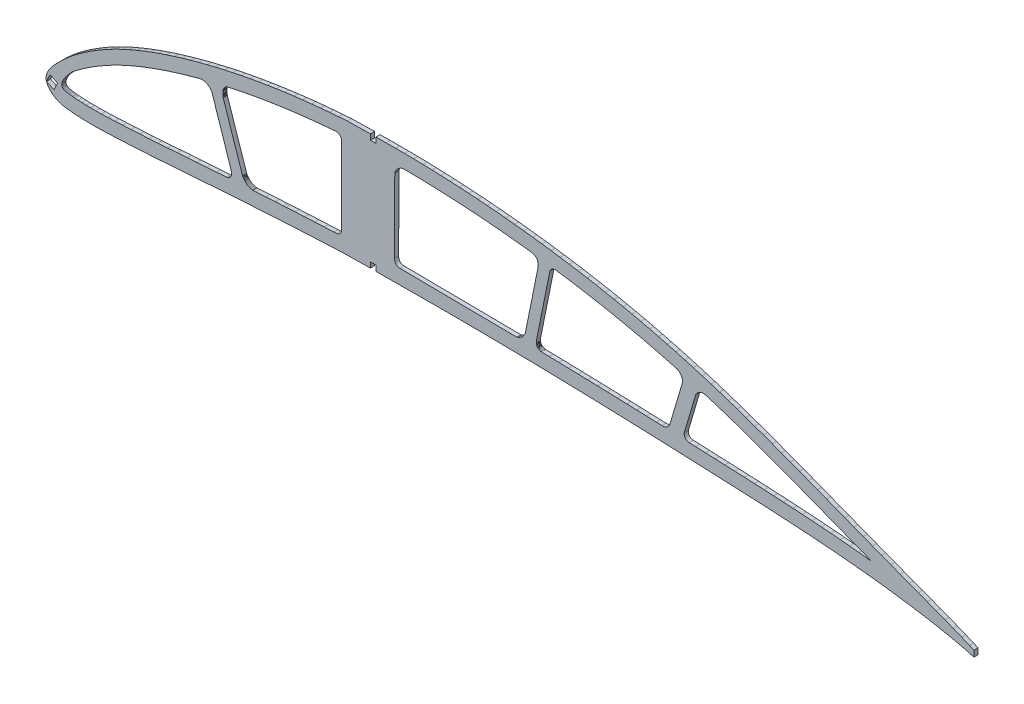
from build123d import *

# Parameters (mm, degrees)
EXTRUDE_1_DEPTH = 1.5


with BuildPart() as part:
    # Model → 凸台-拉伸1 (new body)
    with BuildSketch(Plane.XY):
        Polygon((1022.285988873, 336.232076492), (1020.744827383, 336.919176025), (1017.858271587, 338.113156193), (1014.875083921, 339.316478822), (1011.812851023, 340.521162048), (1008.669851633, 341.732308544), (1005.459341672, 342.954193887), (1002.194411643, 344.18809822), (998.898357391, 345.438744202), (995.584716502, 346.697372048), (992.264582519, 347.965372179), (988.932907909, 349.242021816), (985.600400239, 350.521722028), (982.271108565, 351.805250736), (978.942870508, 353.089722783), (975.626448777, 354.370537718), (972.32883272, 355.647309564), (969.044754248, 356.915321625), (965.765668169, 358.183057988), (962.483476374, 359.448962812), (959.197958306, 360.709042184), (955.925812402, 361.957366335), (952.669703262, 363.187778975), (949.432516041, 364.398117727), (946.220798972, 365.580008784), (943.019630016, 366.735277721), (939.836053664, 367.864537038), (936.671680893, 368.960687106), (933.513421204, 370.022447782), (930.358720276, 371.057972314), (927.212962446, 372.0559466), (924.058616216, 373.025350983), (920.903669413, 373.965744346), (917.746903003, 374.873187913), (914.58243639, 375.750009479), (911.409381377, 376.598261143), (908.234672174, 377.416558447), (905.05315097, 378.202181653), (901.864094982, 378.960178296), (898.669170332, 379.684447223), (895.46571242, 380.381144725), (892.25344555, 381.045278409), (889.029594842, 381.681007609), (885.794105158, 382.287333846), (882.549194014, 382.868140756), (879.298524486, 383.417216907), (876.033330825, 383.939052472), (872.753613031, 384.43364745), (869.466581014, 384.904609778), (866.171015735, 385.348000682), (862.87013319, 385.767648656), (859.56365768, 386.158561309), (856.25386186, 386.525620753), (852.940525173, 386.864833074), (849.623813038, 387.179193708), (846.310549385, 387.465321242), (842.991747907, 387.723711932), (839.672676695, 387.959082473), (836.356943687, 388.164222957), (833.036726472, 388.342569936), (829.721121637, 388.49562411), (826.407801387, 388.617504888), (823.091105689, 388.714533979), (819.784847824, 388.782943992), (816.475827011, 388.819457827), (813.17047524, 388.831732477), (809.872400447, 388.812558031), (806.174178621, 388.812558031), (806.174178621, 386.812558031), (804.174178621, 386.812558031), (804.174178621, 388.812558031), (795.908134102, 388.649264998), (792.642971935, 388.415074852), (789.38268933, 388.148694803), (786.131458346, 387.854982206), (782.895100831, 387.528730711), (779.668619832, 387.170114814), (776.459080883, 386.780889003), (773.263311313, 386.356161019), (770.081380923, 385.897929646), (766.915253594, 385.405125694), (763.762895645, 384.87681957), (760.627305248, 384.312906576), (757.504449941, 383.712526919), (754.40342894, 383.078364677), (751.318001603, 382.40363351), (748.25237489, 381.694190166), (745.207443494, 380.947001572), (742.187309677, 380.164926303), (739.193902421, 379.345895778), (736.241492394, 378.497416532), (733.330764891, 377.610459146), (730.464962382, 376.691914659), (727.654903667, 375.736402221), (724.899763853, 374.748953687), (722.213569312, 373.730079854), (719.598249026, 372.677712142), (717.060938329, 371.595603817), (714.612839917, 370.48936733), (712.261634821, 369.349728968), (710.000606501, 368.184928153), (707.844060525, 367.00347081), (705.799376523, 365.816105942), (703.877966587, 364.634442345), (702.089453426, 363.476154956), (700.443320151, 362.354921154), (698.943983118, 361.282594029), (697.589513346, 360.261242162), (696.369126931, 359.297245794), (695.274898547, 358.3928829), (694.295625497, 357.542541031), (693.41731631, 356.74670878), (692.626978904, 356.005839841), (691.915409367, 355.314251963), (691.270545207, 354.670365159), (690.684251702, 354.070461062), (690.150358009, 353.509752114), (689.66858493, 352.98024319), (689.231692436, 352.475182849), (688.838576435, 351.991607818), (688.486064258, 351.524625843), (688.169124052, 351.07341203), (687.886651726, 350.635003105), (687.641540756, 350.206296198), (687.43172256, 349.785362326), (687.253234475, 349.373340477), (687.112967538, 348.966988184), (687.009922357, 348.566340345), (686.940206069, 348.174534731), (686.883421531, 347.791292146), (686.891007332, 347.406793179), (686.945424903, 347.016656372), (687.047848134, 346.625843781), (687.194419058, 346.238492565), (687.384208085, 345.856636407), (687.616285622, 345.482308988), (687.886689005, 345.116649296), (688.193349654, 344.757728349), (688.537406558, 344.40950881), (688.917860325, 344.072025579), (689.332537677, 343.740351501), (689.786854361, 343.426304769), (690.283703852, 343.126782511), (690.821192067, 342.844852699), (691.406559038, 342.587266772), (692.044186222, 342.364878431), (692.737791987, 342.169552952), (693.490618802, 342.008181372), (694.312555876, 341.877416523), (695.211249342, 341.766985302), (696.197518, 341.671506859), (697.285004329, 341.580498694), (698.486874904, 341.498504067), (699.822432249, 341.433854405), (701.31056009, 341.382888445), (702.970630747, 341.355936396), (704.824840216, 341.358226814), (706.892386319, 341.395092954), (709.200531805, 341.473587655), (711.757957094, 341.584402304), (714.561559318, 341.724643429), (717.567910976, 341.882819626), (720.73210928, 342.062500154), (724.006043872, 342.261362626), (727.371900216, 342.485032187), (730.810271092, 342.722179238), (734.303167464, 342.973431969), (737.838212748, 343.228215875), (741.391351765, 343.485369763), (744.950417329, 343.740315472), (748.506310222, 343.990368925), (752.059994937, 344.234495833), (755.612470864, 344.472661295), (759.162738613, 344.704900211), (762.709763892, 344.93024809), (766.252547312, 345.148739831), (769.786057018, 345.359550541), (773.322250802, 345.561262035), (776.852238843, 345.757186581), (780.377845427, 345.942257425), (783.906310585, 346.123226008), (787.421469567, 346.295653767), (790.945204272, 346.455774741), (794.472866742, 346.613757335), (800.696927424, 346.697571942), (803.174274752, 346.745790477), (804.174178621, 346.765252383), (804.174178621, 348.745790477), (806.174178621, 348.745790477), (806.174178621, 346.745790477), (812.062810556, 346.745790477), (815.578045509, 346.78001368), (819.089899048, 346.807412951), (822.590273065, 346.82643245), (826.098083514, 346.835026046), (829.607670362, 346.839515447), (833.129741176, 346.834301725), (836.65253477, 346.82404047), (840.186758712, 346.803132753), (843.728639644, 346.775793047), (847.274128514, 346.741243431), (850.82322532, 346.699483906), (854.373933106, 346.650624751), (857.930300927, 346.595443887), (861.481400655, 346.535546327), (865.027122013, 346.468935115), (868.565412903, 346.394722052), (872.098435701, 346.315792294), (875.61010447, 346.231031118), (879.112456093, 346.140775327), (882.608541146, 346.04585798), (886.113226529, 345.943455026), (889.627841559, 345.839502197), (893.167865638, 345.724130951), (896.722811756, 345.60693413), (900.278370376, 345.48269282), (903.841641126, 345.353017998), (907.404801597, 345.22134622), (910.959588261, 345.083126208), (914.515152846, 344.940857142), (918.064671418, 344.797920436), (921.597938634, 344.65087357), (925.121000505, 344.500384187), (928.644172655, 344.351891761), (932.177942093, 344.195803448), (935.719754499, 344.040272497), (939.257297293, 343.879969711), (942.788408098, 343.712009933), (946.309203277, 343.538610681), (949.808534149, 343.357383053), (953.295111321, 343.1628384), (956.765106299, 342.958192717), (960.212252511, 342.738784447), (963.649475042, 342.502898298), (967.062850329, 342.252304702), (970.464139557, 341.98234807), (973.843357941, 341.693579797), (977.214318762, 341.382232493), (980.564317496, 341.054015367), (983.893966644, 340.701883927), (987.203211067, 340.324839697), (990.500038593, 339.922441558), (993.767750784, 339.500619277), (997.003909565, 339.051495306), (1000.208735496, 338.579063558), (1003.362203862, 338.083428348), (1006.460155331, 337.561814799), (1009.486448826, 337.012109709), (1012.449629536, 336.425828992), (1015.337936277, 335.80762824), (1018.152869749, 335.148410864), (1020.891765354, 334.454333155), (1022.285988873, 334.01878307), align=None)
        Polygon((696.769653434, 346.626002776), (697.313396598, 346.580498694), (698.515267174, 346.498504067), (699.850824518, 346.433854405), (701.338952359, 346.382888445), (702.999023017, 346.355936396), (704.853232485, 346.358226814), (706.920778588, 346.395092954), (709.228924074, 346.473587655), (711.786349364, 346.584402304), (714.589951587, 346.724643429), (717.596303245, 346.882819626), (720.760501549, 347.062500154), (724.034436142, 347.261362626), (727.400292485, 347.485032187), (730.838663361, 347.722179238), (734.331559733, 347.973431969), (737.866605017, 348.228215875), (741.419744034, 348.485369763), (744.978809598, 348.740315472), (748.534702492, 348.990368925), (752.088387206, 349.234495833), (752.669531865, 349.273360488), (752.689531865, 349.287360488), (752.709531865, 349.302360488), (752.729531865, 349.316360488), (752.749531865, 349.331360488), (752.769531865, 349.345360488), (752.789531865, 349.359360488), (752.809531865, 349.374360488), (752.829531865, 349.388360488), (752.849531865, 349.403360488), (752.869531865, 349.417360488), (752.889531865, 349.432360488), (752.909531865, 349.446360488), (752.929531865, 349.461360488), (752.949531865, 349.475360488), (752.969531865, 349.490360488), (752.989531865, 349.505360488), (753.009531865, 349.519360488), (753.029531865, 349.534360488), (753.049531865, 349.549360488), (753.069531865, 349.564360488), (753.089531865, 349.578360488), (753.109531865, 349.593360488), (753.129531865, 349.608360488), (753.149531865, 349.623360488), (753.169531865, 349.638360488), (753.189531865, 349.653360488), (753.199531865, 349.668360488), (753.219531865, 349.683360488), (753.239531865, 349.699360488), (753.259531865, 349.714360488), (753.279531865, 349.729360488), (753.299531865, 349.745360488), (753.309531865, 349.760360488), (753.329531865, 349.776360488), (753.349531865, 349.791360488), (753.369531865, 349.807360488), (753.379531865, 349.823360488), (753.399531865, 349.839360488), (753.419531865, 349.854360488), (753.429531865, 349.870360488), (753.449531865, 349.886360488), (753.469531865, 349.903360488), (753.479531865, 349.919360488), (753.499531865, 349.935360488), (753.509531865, 349.952360488), (753.529531865, 349.968360488), (753.539531865, 349.985360488), (753.559531865, 350.001360488), (753.569531865, 350.018360488), (753.589531865, 350.035360488), (753.599531865, 350.052360488), (753.619531865, 350.069360488), (753.629531865, 350.086360488), (753.639531865, 350.104360488), (753.659531865, 350.121360488), (753.669531865, 350.139360488), (753.679531865, 350.156360488), (753.699531865, 350.174360488), (753.709531865, 350.192360488), (753.719531865, 350.210360488), (753.729531865, 350.228360488), (753.739531865, 350.246360488), (753.749531865, 350.265360488), (753.759531865, 350.283360488), (753.769531865, 350.302360488), (753.779531865, 350.320360488), (753.789531865, 350.339360488), (753.799531865, 350.358360488), (753.809531865, 350.377360488), (753.819531865, 350.397360488), (753.829531865, 350.416360488), (753.839531865, 350.436360488), (753.839531865, 350.455360488), (753.849531865, 350.475360488), (753.859531865, 350.495360488), (753.869531865, 350.515360488), (753.869531865, 350.535360488), (753.879531865, 350.556360488), (753.879531865, 350.576360488), (753.889531865, 350.597360488), (753.899531865, 350.617360488), (753.899531865, 350.638360488), (753.909531865, 350.659360488), (753.909531865, 350.680360488), (753.909531865, 350.701360488), (753.919531865, 350.722360488), (753.919531865, 350.744360488), (753.929531865, 350.765360488), (753.929531865, 350.787360488), (753.929531865, 350.808360488), (753.939531865, 350.830360488), (753.939531865, 350.852360488), (753.939531865, 350.874360488), (753.939531865, 350.896360488), (753.939531865, 350.918360488), (753.949531865, 350.940360488), (753.949531865, 350.963360488), (753.949531865, 350.985360488), (753.949531865, 351.008360488), (753.949531865, 351.030360488), (753.949531865, 351.053360488), (753.949531865, 351.076360488), (753.949531865, 351.099360488), (753.949531865, 351.121360488), (753.949531865, 351.145360488), (753.949531865, 351.168360488), (753.949531865, 351.191360488), (753.949531865, 351.214360488), (753.949531865, 351.237360488), (753.949531865, 351.261360488), (753.949531865, 351.284360488), (753.939531865, 351.308360488), (753.939531865, 351.331360488), (753.939531865, 351.355360488), (753.939531865, 351.379360488), (753.939531865, 351.403360488), (753.929531865, 351.427360488), (753.929531865, 351.451360488), (753.929531865, 351.475360488), (753.929531865, 351.499360488), (753.919531865, 351.523360488), (753.919531865, 351.547360488), (753.919531865, 351.571360488), (753.909531865, 351.595360488), (753.909531865, 351.620360488), (753.909531865, 351.644360488), (753.899531865, 351.669360488), (753.899531865, 351.693360488), (753.899531865, 351.718360488), (753.889531865, 351.742360488), (753.889531865, 351.767360488), (753.879531865, 351.792360488), (753.879531865, 351.816360488), (753.879531865, 351.841360488), (753.869531865, 351.866360488), (753.869531865, 351.891360488), (753.859531865, 351.915360488), (753.859531865, 351.940360488), (753.849531865, 351.965360488), (753.849531865, 351.990360488), (753.839531865, 352.015360488), (753.839531865, 352.040360488), (753.829531865, 352.065360488), (753.829531865, 352.090360488), (753.819531865, 352.115360488), (753.819531865, 352.140360488), (753.809531865, 352.165360488), (753.809531865, 352.191360488), (753.799531865, 352.216360488), (753.799531865, 352.241360488), (753.789531865, 352.266360488), (753.789531865, 352.291360488), (753.779531865, 352.316360488), (753.769531865, 352.342360488), (753.769531865, 352.367360488), (753.759531865, 352.392360488), (753.759531865, 352.417360488), (753.749531865, 352.442360488), (753.749531865, 352.468360488), (746.739531865, 373.525360488), (746.719531865, 373.545360488), (746.699531865, 373.565360488), (746.679531865, 373.586360488), (746.669531865, 373.606360488), (746.649531865, 373.626360488), (746.629531865, 373.647360488), (746.609531865, 373.667360488), (746.589531865, 373.687360488), (746.569531865, 373.708360488), (746.549531865, 373.728360488), (746.529531865, 373.748360488), (746.519531865, 373.768360488), (746.499531865, 373.788360488), (746.479531865, 373.808360488), (746.459531865, 373.829360488), (746.439531865, 373.849360488), (746.419531865, 373.869360488), (746.399531865, 373.889360488), (746.379531865, 373.908360488), (746.359531865, 373.928360488), (746.349531865, 373.948360488), (746.329531865, 373.968360488), (746.309531865, 373.988360488), (746.289531865, 374.007360488), (746.269531865, 374.027360488), (746.249531865, 374.046360488), (746.229531865, 374.066360488), (746.209531865, 374.085360488), (746.189531865, 374.104360488), (746.169531865, 374.123360488), (746.149531865, 374.143360488), (746.129531865, 374.162360488), (746.109531865, 374.181360488), (746.099531865, 374.199360488), (746.079531865, 374.218360488), (746.059531865, 374.237360488), (746.039531865, 374.255360488), (746.019531865, 374.274360488), (745.999531865, 374.292360488), (745.979531865, 374.310360488), (745.959531865, 374.329360488), (745.939531865, 374.347360488), (745.919531865, 374.365360488), (745.899531865, 374.382360488), (745.879531865, 374.400360488), (745.859531865, 374.418360488), (745.839531865, 374.435360488), (745.819531865, 374.452360488), (745.799531865, 374.470360488), (745.779531865, 374.487360488), (745.759531865, 374.504360488), (745.739531865, 374.520360488), (745.709531865, 374.537360488), (745.689531865, 374.553360488), (745.669531865, 374.570360488), (745.649531865, 374.586360488), (745.629531865, 374.602360488), (745.609531865, 374.618360488), (745.589531865, 374.634360488), (745.569531865, 374.649360488), (745.549531865, 374.665360488), (745.529531865, 374.680360488), (745.499531865, 374.695360488), (745.479531865, 374.710360488), (745.459531865, 374.725360488), (745.439531865, 374.739360488), (745.419531865, 374.754360488), (745.399531865, 374.768360488), (745.369531865, 374.782360488), (745.349531865, 374.796360488), (745.329531865, 374.809360488), (745.309531865, 374.823360488), (745.289531865, 374.836360488), (745.259531865, 374.849360488), (745.239531865, 374.862360488), (745.219531865, 374.875360488), (745.199531865, 374.887360488), (745.169531865, 374.899360488), (745.149531865, 374.911360488), (745.129531865, 374.923360488), (745.099531865, 374.935360488), (745.079531865, 374.946360488), (745.059531865, 374.957360488), (745.029531865, 374.968360488), (745.009531865, 374.979360488), (744.989531865, 374.990360488), (744.959531865, 375.000360488), (744.939531865, 375.010360488), (744.909531865, 375.020360488), (744.889531865, 375.030360488), (744.869531865, 375.039360488), (744.839531865, 375.049360488), (744.819531865, 375.058360488), (744.789531865, 375.067360488), (744.769531865, 375.076360488), (744.739531865, 375.084360488), (744.719531865, 375.093360488), (744.689531865, 375.101360488), (744.669531865, 375.109360488), (744.639531865, 375.117360488), (744.619531865, 375.125360488), (744.589531865, 375.133360488), (744.569531865, 375.140360488), (744.539531865, 375.148360488), (744.519531865, 375.155360488), (744.489531865, 375.162360488), (744.469531865, 375.169360488), (744.439531865, 375.176360488), (744.419531865, 375.182360488), (744.389531865, 375.189360488), (744.359531865, 375.195360488), (744.339531865, 375.201360488), (744.309531865, 375.207360488), (744.289531865, 375.213360488), (744.259531865, 375.219360488), (744.229531865, 375.225360488), (744.209531865, 375.230360488), (744.179531865, 375.236360488), (744.159531865, 375.241360488), (744.129531865, 375.246360488), (744.099531865, 375.251360488), (744.079531865, 375.256360488), (744.049531865, 375.261360488), (744.019531865, 375.266360488), (743.999531865, 375.271360488), (743.969531865, 375.275360488), (743.939531865, 375.280360488), (743.919531865, 375.284360488), (743.889531865, 375.289360488), (743.859531865, 375.293360488), (743.839531865, 375.297360488), (743.809531865, 375.301360488), (743.779531865, 375.305360488), (743.749531865, 375.309360488), (743.729531865, 375.313360488), (743.699531865, 375.317360488), (743.669531865, 375.321360488), (743.649531865, 375.325360488), (743.619531865, 375.328360488), (743.589531865, 375.332360488), (743.559531865, 375.336360488), (743.539531865, 375.339360488), (743.509531865, 375.342360488), (743.479531865, 375.346360488), (743.459531865, 375.349360488), (743.429531865, 375.353360488), (743.399531865, 375.356360488), (743.369531865, 375.359360488), (743.349531865, 375.362360488), (743.319531865, 375.366360488), (743.289531865, 375.369360488), (743.259531865, 375.372360488), (743.239531865, 375.375360488), (743.209531865, 375.378360488), (743.179531865, 375.381360488), (743.149531865, 375.384360488), (743.129531865, 375.387360488), (743.099531865, 375.390360488), (743.071523706, 375.393896927), (742.187309677, 375.164926303), (739.193902421, 374.345895778), (736.241492394, 373.497416532), (733.330764891, 372.610459146), (730.464962382, 371.691914659), (727.654903667, 370.736402221), (724.899763853, 369.748953687), (722.213569312, 368.730079854), (719.598249026, 367.677712142), (717.060938329, 366.595603817), (714.612839917, 365.48936733), (712.261634821, 364.349728968), (710.000606501, 363.184928153), (707.844060525, 362.00347081), (705.799376523, 360.816105942), (703.877966587, 359.634442345), (702.089453426, 358.476154956), (700.443320151, 357.354921154), (698.943983118, 356.282594029), (697.589513346, 355.261242162), (696.369126931, 354.297245794), (695.289531865, 353.081360488), (695.259531865, 353.043360488), (695.219531865, 353.004360488), (695.189531865, 352.965360488), (695.149531865, 352.926360488), (695.119531865, 352.887360488), (695.079531865, 352.849360488), (695.049531865, 352.810360488), (695.009531865, 352.771360488), (694.979531865, 352.732360488), (694.939531865, 352.693360488), (694.909531865, 352.654360488), (694.879531865, 352.615360488), (694.839531865, 352.576360488), (694.809531865, 352.537360488), (694.769531865, 352.497360488), (694.739531865, 352.458360488), (694.699531865, 352.419360488), (694.669531865, 352.379360488), (694.629531865, 352.340360488), (694.599531865, 352.300360488), (694.569531865, 352.261360488), (694.529531865, 352.221360488), (694.499531865, 352.181360488), (694.469531865, 352.141360488), (694.429531865, 352.101360488), (694.399531865, 352.061360488), (694.359531865, 352.021360488), (694.329531865, 351.981360488), (694.299531865, 351.940360488), (694.269531865, 351.900360488), (694.229531865, 351.859360488), (694.199531865, 351.818360488), (694.169531865, 351.777360488), (694.129531865, 351.736360488), (694.099531865, 351.695360488), (694.069531865, 351.653360488), (694.039531865, 351.612360488), (694.009531865, 351.570360488), (693.969531865, 351.528360488), (693.939531865, 351.486360488), (693.909531865, 351.444360488), (693.879531865, 351.402360488), (693.849531865, 351.359360488), (693.819531865, 351.317360488), (693.789531865, 351.274360488), (693.759531865, 351.231360488), (693.729531865, 351.187360488), (693.699531865, 351.144360488), (693.669531865, 351.100360488), (693.639531865, 351.056360488), (693.609531865, 351.012360488), (693.579531865, 350.968360488), (693.549531865, 350.924360488), (693.519531865, 350.879360488), (693.489531865, 350.834360488), (693.469531865, 350.789360488), (693.439531865, 350.743360488), (693.409531865, 350.698360488), (693.379531865, 350.652360488), (693.359531865, 350.606360488), (693.329531865, 350.559360488), (693.299531865, 350.513360488), (693.279531865, 350.466360488), (693.249531865, 350.419360488), (693.219531865, 350.371360488), (693.199531865, 350.324360488), (693.169531865, 350.276360488), (693.149531865, 350.228360488), (693.119531865, 350.179360488), (693.099531865, 350.130360488), (693.079531865, 350.081360488), (693.049531865, 350.032360488), (693.029531865, 349.982360488), (692.999531865, 349.932360488), (692.979531865, 349.882360488), (692.959531865, 349.831360488), (692.939531865, 349.780360488), (692.919531865, 349.729360488), (692.889531865, 349.678360488), (692.869531865, 349.626360488), (692.849531865, 349.574360488), (692.829531865, 349.521360488), (692.809531865, 349.468360488), (692.789531865, 349.415360488), (692.769531865, 349.362360488), (692.749531865, 349.308360488), (692.739531865, 349.255360488), (692.719531865, 349.201360488), (692.699531865, 349.148360488), (692.689531865, 349.094360488), (692.669531865, 349.041360488), (692.659531865, 348.988360488), (692.639531865, 348.935360488), (692.629531865, 348.882360488), (692.619531865, 348.830360488), (692.609531865, 348.777360488), (692.599531865, 348.726360488), (692.589531865, 348.675360488), (692.589531865, 348.624360488), (692.579531865, 348.574360488), (692.579531865, 348.525360488), (692.579531865, 348.476360488), (692.569531865, 348.428360488), (692.569531865, 348.381360488), (692.579531865, 348.335360488), (692.579531865, 348.289360488), (692.579531865, 348.245360488), (692.589531865, 348.201360488), (692.599531865, 348.158360488), (692.609531865, 348.116360488), (692.619531865, 348.075360488), (692.629531865, 348.035360488), (692.649531865, 347.996360488), (692.659531865, 347.957360488), (692.679531865, 347.919360488), (692.699531865, 347.882360488), (692.719531865, 347.846360488), (692.739531865, 347.811360488), (692.759531865, 347.776360488), (692.789531865, 347.743360488), (692.809531865, 347.709360488), (692.839531865, 347.677360488), (692.869531865, 347.645360488), (692.889531865, 347.615360488), (692.929531865, 347.584360488), (692.959531865, 347.555360488), (692.989531865, 347.526360488), (693.019531865, 347.498360488), (693.059531865, 347.470360488), (693.099531865, 347.444360488), (693.129531865, 347.417360488), (693.169531865, 347.392360488), (693.209531865, 347.367360488), (693.249531865, 347.343360488), (693.289531865, 347.319360488), (693.339531865, 347.296360488), (693.379531865, 347.273360488), (693.429531865, 347.251360488), (693.469531865, 347.230360488), (693.519531865, 347.209360488), (693.569531865, 347.189360488), (693.619531865, 347.169360488), (693.669531865, 347.150360488), (693.719531865, 347.131360488), (693.769531865, 347.113360488), (693.819531865, 347.095360488), (693.869531865, 347.077360488), (693.929531865, 347.061360488), (693.979531865, 347.044360488), (694.039531865, 347.028360488), (694.099531865, 347.013360488), (694.149531865, 346.998360488), (694.209531865, 346.983360488), (694.269531865, 346.969360488), (694.329531865, 346.955360488), (694.389531865, 346.941360488), (694.449531865, 346.928360488), (694.509531865, 346.915360488), (694.569531865, 346.903360488), (694.639531865, 346.891360488), (694.699531865, 346.879360488), (694.759531865, 346.868360488), (694.829531865, 346.856360488), (694.889531865, 346.846360488), (694.959531865, 346.835360488), (695.019531865, 346.825360488), (695.089531865, 346.815360488), (695.159531865, 346.805360488), (695.219531865, 346.795360488), (695.289531865, 346.786360488), (695.359531865, 346.777360488), (695.429531865, 346.768360488), (695.489531865, 346.759360488), (695.559531865, 346.751360488), (695.629531865, 346.743360488), (695.699531865, 346.735360488), (695.769531865, 346.727360488), (695.839531865, 346.719360488), (695.909531865, 346.711360488), (695.979531865, 346.703360488), (696.049531865, 346.696360488), (696.129531865, 346.689360488), (696.199531865, 346.681360488), (696.269531865, 346.674360488), (696.339531865, 346.667360488), (696.409531865, 346.660360488), (696.479531865, 346.653360488), (696.549531865, 346.646360488), (696.629531865, 346.639360488), (696.699531865, 346.633360488), align=None, mode=Mode.SUBTRACT)
        with BuildLine():
            Line((761.669531865, 349.862360488), (762.738156162, 349.93024809))
            Line((762.738156162, 349.93024809), (766.280939581, 350.148739831))
            Line((766.280939581, 350.148739831), (769.814449288, 350.359550541))
            Line((769.814449288, 350.359550541), (772.759773773, 350.52755768))
            Line((772.759773773, 350.52755768), (773.805423083, 350.586503641))
            Line((773.805423083, 350.586503641), (776.880631112, 350.757186581))
            Line((776.880631112, 350.757186581), (780.406237696, 350.942257425))
            Line((780.406237696, 350.942257425), (783.934702854, 351.123226008))
            Line((783.934702854, 351.123226008), (787.449861836, 351.295653767))
            Line((787.449861836, 351.295653767), (790.973596541, 351.455774741))
            Line((790.973596541, 351.455774741), (791.858642175, 351.495410564))
            ThreePointArc((791.858642175, 351.495410564), (793.214666739, 352.111191704), (793.769163996, 353.493407975))
            Line((793.769163996, 353.493407975), (793.769163996, 381.356141742))
            ThreePointArc((793.769163996, 381.356141742), (793.118258139, 382.832605421), (791.589219001, 383.348030243))
            Line((791.589219001, 383.348030243), (786.131458346, 382.854982206))
            Line((786.131458346, 382.854982206), (782.895100831, 382.528730711))
            Line((782.895100831, 382.528730711), (779.668619832, 382.170114814))
            Line((779.668619832, 382.170114814), (776.459080883, 381.780889003))
            Line((776.459080883, 381.780889003), (773.263311313, 381.356161019))
            Line((773.263311313, 381.356161019), (770.081380923, 380.897929646))
            Line((770.081380923, 380.897929646), (769.160422731, 380.754583599))
            Line((769.160422731, 380.754583599), (766.915253594, 380.405125694))
            Line((766.915253594, 380.405125694), (763.762895645, 379.87681957))
            Line((763.762895645, 379.87681957), (760.627305248, 379.312906576))
            Line((760.627305248, 379.312906576), (757.504449941, 378.712526919))
            Line((757.504449941, 378.712526919), (754.40342894, 378.078364677))
            Line((754.40342894, 378.078364677), (752.063513993, 377.566664556))
            Line((752.063513993, 377.566664556), (752.039531865, 377.545360488))
            Line((752.039531865, 377.545360488), (752.019531865, 377.524360488))
            Line((752.019531865, 377.524360488), (751.999531865, 377.503360488))
            Line((751.999531865, 377.503360488), (751.979531865, 377.482360488))
            Line((751.979531865, 377.482360488), (751.959531865, 377.461360488))
            Line((751.959531865, 377.461360488), (751.939531865, 377.439360488))
            Line((751.939531865, 377.439360488), (751.919531865, 377.418360488))
            Line((751.919531865, 377.418360488), (751.899531865, 377.397360488))
            Line((751.899531865, 377.397360488), (751.879531865, 377.376360488))
            Line((751.879531865, 377.376360488), (751.859531865, 377.355360488))
            Line((751.859531865, 377.355360488), (751.839531865, 377.333360488))
            Line((751.839531865, 377.333360488), (751.819531865, 377.312360488))
            Line((751.819531865, 377.312360488), (751.799531865, 377.291360488))
            Line((751.799531865, 377.291360488), (751.779531865, 377.269360488))
            Line((751.779531865, 377.269360488), (751.759531865, 377.248360488))
            Line((751.759531865, 377.248360488), (751.739531865, 377.227360488))
            Line((751.739531865, 377.227360488), (751.719531865, 377.205360488))
            Line((751.719531865, 377.205360488), (751.699531865, 377.184360488))
            Line((751.699531865, 377.184360488), (751.679531865, 377.162360488))
            Line((751.679531865, 377.162360488), (751.659531865, 377.141360488))
            Line((751.659531865, 377.141360488), (751.639531865, 377.119360488))
            Line((751.639531865, 377.119360488), (751.619531865, 377.098360488))
            Line((751.619531865, 377.098360488), (751.599531865, 377.076360488))
            Line((751.599531865, 377.076360488), (751.579531865, 377.054360488))
            Line((751.579531865, 377.054360488), (751.559531865, 377.033360488))
            Line((751.559531865, 377.033360488), (751.539531865, 377.011360488))
            Line((751.539531865, 377.011360488), (751.519531865, 376.989360488))
            Line((751.519531865, 376.989360488), (751.509531865, 376.967360488))
            Line((751.509531865, 376.967360488), (751.489531865, 376.945360488))
            Line((751.489531865, 376.945360488), (751.469531865, 376.923360488))
            Line((751.469531865, 376.923360488), (751.449531865, 376.901360488))
            Line((751.449531865, 376.901360488), (751.429531865, 376.879360488))
            Line((751.429531865, 376.879360488), (751.419531865, 376.857360488))
            Line((751.419531865, 376.857360488), (751.399531865, 376.835360488))
            Line((751.399531865, 376.835360488), (751.379531865, 376.812360488))
            Line((751.379531865, 376.812360488), (751.359531865, 376.790360488))
            Line((751.359531865, 376.790360488), (751.349531865, 376.767360488))
            Line((751.349531865, 376.767360488), (751.329531865, 376.745360488))
            Line((751.329531865, 376.745360488), (751.309531865, 376.722360488))
            Line((751.309531865, 376.722360488), (751.299531865, 376.700360488))
            Line((751.299531865, 376.700360488), (751.279531865, 376.677360488))
            Line((751.279531865, 376.677360488), (751.259531865, 376.654360488))
            Line((751.259531865, 376.654360488), (751.249531865, 376.631360488))
            Line((751.249531865, 376.631360488), (751.229531865, 376.608360488))
            Line((751.229531865, 376.608360488), (751.219531865, 376.585360488))
            Line((751.219531865, 376.585360488), (751.199531865, 376.562360488))
            Line((751.199531865, 376.562360488), (751.189531865, 376.539360488))
            Line((751.189531865, 376.539360488), (751.169531865, 376.515360488))
            Line((751.169531865, 376.515360488), (751.159531865, 376.492360488))
            Line((751.159531865, 376.492360488), (751.139531865, 376.468360488))
            Line((751.139531865, 376.468360488), (751.129531865, 376.445360488))
            Line((751.129531865, 376.445360488), (751.119531865, 376.421360488))
            Line((751.119531865, 376.421360488), (751.099531865, 376.397360488))
            Line((751.099531865, 376.397360488), (751.089531865, 376.373360488))
            Line((751.089531865, 376.373360488), (751.079531865, 376.349360488))
            Line((751.079531865, 376.349360488), (751.069531865, 376.325360488))
            Line((751.069531865, 376.325360488), (751.049531865, 376.300360488))
            Line((751.049531865, 376.300360488), (751.039531865, 376.276360488))
            Line((751.039531865, 376.276360488), (751.029531865, 376.252360488))
            Line((751.029531865, 376.252360488), (751.019531865, 376.227360488))
            Line((751.019531865, 376.227360488), (751.009531865, 376.202360488))
            Line((751.009531865, 376.202360488), (750.999531865, 376.177360488))
            Line((750.999531865, 376.177360488), (750.989531865, 376.152360488))
            Line((750.989531865, 376.152360488), (750.979531865, 376.127360488))
            Line((750.979531865, 376.127360488), (750.969531865, 376.102360488))
            Line((750.969531865, 376.102360488), (750.959531865, 376.077360488))
            Line((750.959531865, 376.077360488), (750.949531865, 376.052360488))
            Line((750.949531865, 376.052360488), (750.939531865, 376.026360488))
            Line((750.939531865, 376.026360488), (750.929531865, 376.000360488))
            Line((750.929531865, 376.000360488), (750.929531865, 375.975360488))
            Line((750.929531865, 375.975360488), (750.919531865, 375.949360488))
            Line((750.919531865, 375.949360488), (750.909531865, 375.923360488))
            Line((750.909531865, 375.923360488), (750.899531865, 375.897360488))
            Line((750.899531865, 375.897360488), (750.899531865, 375.871360488))
            Line((750.899531865, 375.871360488), (750.889531865, 375.845360488))
            Line((750.889531865, 375.845360488), (750.879531865, 375.818360488))
            Line((750.879531865, 375.818360488), (750.879531865, 375.792360488))
            Line((750.879531865, 375.792360488), (750.869531865, 375.766360488))
            Line((750.869531865, 375.766360488), (750.859531865, 375.739360488))
            Line((750.859531865, 375.739360488), (750.859531865, 375.712360488))
            Line((750.859531865, 375.712360488), (750.849531865, 375.686360488))
            Line((750.849531865, 375.686360488), (750.849531865, 375.659360488))
            Line((750.849531865, 375.659360488), (750.839531865, 375.632360488))
            Line((750.839531865, 375.632360488), (750.839531865, 375.605360488))
            Line((750.839531865, 375.605360488), (750.839531865, 375.578360488))
            Line((750.839531865, 375.578360488), (750.829531865, 375.551360488))
            Line((750.829531865, 375.551360488), (750.829531865, 375.523360488))
            Line((750.829531865, 375.523360488), (750.819531865, 375.496360488))
            Line((750.819531865, 375.496360488), (750.819531865, 375.469360488))
            Line((750.819531865, 375.469360488), (750.819531865, 375.441360488))
            Line((750.819531865, 375.441360488), (750.819531865, 375.413360488))
            Line((750.819531865, 375.413360488), (750.809531865, 375.386360488))
            Line((750.809531865, 375.386360488), (750.809531865, 375.358360488))
            Line((750.809531865, 375.358360488), (750.809531865, 375.330360488))
            Line((750.809531865, 375.330360488), (750.809531865, 375.302360488))
            Line((750.809531865, 375.302360488), (750.799531865, 375.274360488))
            Line((750.799531865, 375.274360488), (750.799531865, 375.246360488))
            Line((750.799531865, 375.246360488), (750.799531865, 375.218360488))
            Line((750.799531865, 375.218360488), (750.799531865, 375.190360488))
            Line((750.799531865, 375.190360488), (750.799531865, 375.162360488))
            Line((750.799531865, 375.162360488), (750.799531865, 375.133360488))
            Line((750.799531865, 375.133360488), (750.799531865, 375.105360488))
            Line((750.799531865, 375.105360488), (750.799531865, 375.077360488))
            Line((750.799531865, 375.077360488), (750.799531865, 375.048360488))
            Line((750.799531865, 375.048360488), (750.799531865, 375.020360488))
            Line((750.799531865, 375.020360488), (750.799531865, 374.991360488))
            Line((750.799531865, 374.991360488), (750.799531865, 374.962360488))
            Line((750.799531865, 374.962360488), (750.799531865, 374.933360488))
            Line((750.799531865, 374.933360488), (750.799531865, 374.905360488))
            Line((750.799531865, 374.905360488), (750.799531865, 374.876360488))
            Line((750.799531865, 374.876360488), (750.799531865, 374.847360488))
            Line((750.799531865, 374.847360488), (750.799531865, 374.818360488))
            Line((750.799531865, 374.818360488), (750.799531865, 374.789360488))
            Line((750.799531865, 374.789360488), (750.799531865, 374.760360488))
            Line((750.799531865, 374.760360488), (750.799531865, 374.731360488))
            Line((750.799531865, 374.731360488), (750.799531865, 374.701360488))
            Line((750.799531865, 374.701360488), (750.809531865, 374.672360488))
            Line((750.809531865, 374.672360488), (750.809531865, 374.643360488))
            Line((750.809531865, 374.643360488), (750.809531865, 374.614360488))
            Line((750.809531865, 374.614360488), (750.809531865, 374.584360488))
            Line((750.809531865, 374.584360488), (750.809531865, 374.555360488))
            Line((750.809531865, 374.555360488), (750.819531865, 374.525360488))
            Line((750.819531865, 374.525360488), (750.819531865, 374.496360488))
            Line((750.819531865, 374.496360488), (750.819531865, 374.466360488))
            Line((750.819531865, 374.466360488), (750.819531865, 374.437360488))
            Line((750.819531865, 374.437360488), (750.829531865, 374.407360488))
            Line((750.829531865, 374.407360488), (750.829531865, 374.377360488))
            Line((750.829531865, 374.377360488), (750.829531865, 374.348360488))
            Line((750.829531865, 374.348360488), (750.829531865, 374.318360488))
            Line((750.829531865, 374.318360488), (750.839531865, 374.288360488))
            Line((750.839531865, 374.288360488), (750.839531865, 374.258360488))
            Line((750.839531865, 374.258360488), (750.839531865, 374.229360488))
            Line((750.839531865, 374.229360488), (750.849531865, 374.199360488))
            Line((750.849531865, 374.199360488), (750.849531865, 374.169360488))
            Line((750.849531865, 374.169360488), (750.849531865, 374.139360488))
            Line((750.849531865, 374.139360488), (750.859531865, 374.109360488))
            Line((750.859531865, 374.109360488), (750.859531865, 374.079360488))
            Line((750.859531865, 374.079360488), (750.859531865, 374.049360488))
            Line((750.859531865, 374.049360488), (750.869531865, 374.019360488))
            Line((750.869531865, 374.019360488), (750.869531865, 373.989360488))
            Line((750.869531865, 373.989360488), (750.879531865, 373.959360488))
            Line((750.879531865, 373.959360488), (750.879531865, 373.929360488))
            Line((750.879531865, 373.929360488), (750.879531865, 373.899360488))
            Line((750.879531865, 373.899360488), (750.889531865, 373.868360488))
            Line((750.889531865, 373.868360488), (750.889531865, 373.838360488))
            Line((750.889531865, 373.838360488), (750.899531865, 373.808360488))
            Line((750.899531865, 373.808360488), (750.899531865, 373.778360488))
            Line((750.899531865, 373.778360488), (750.909531865, 373.748360488))
            Line((750.909531865, 373.748360488), (750.909531865, 373.718360488))
            Line((750.909531865, 373.718360488), (750.909531865, 373.687360488))
            Line((750.909531865, 373.687360488), (750.919531865, 373.657360488))
            Line((750.919531865, 373.657360488), (750.919531865, 373.627360488))
            Line((750.919531865, 373.627360488), (750.929531865, 373.597360488))
            Line((750.929531865, 373.597360488), (750.929531865, 373.566360488))
            Line((750.929531865, 373.566360488), (750.939531865, 373.536360488))
            Line((750.939531865, 373.536360488), (750.939531865, 373.506360488))
            Line((750.939531865, 373.506360488), (750.939531865, 373.476360488))
            Line((750.939531865, 373.476360488), (750.949531865, 373.445360488))
            Line((750.949531865, 373.445360488), (750.949531865, 373.415360488))
            Line((750.949531865, 373.415360488), (757.929531865, 352.540360488))
            Line((757.929531865, 352.540360488), (757.939531865, 352.514360488))
            Line((757.939531865, 352.514360488), (757.959531865, 352.488360488))
            Line((757.959531865, 352.488360488), (757.979531865, 352.462360488))
            Line((757.979531865, 352.462360488), (757.999531865, 352.435360488))
            Line((757.999531865, 352.435360488), (758.009531865, 352.409360488))
            Line((758.009531865, 352.409360488), (758.029531865, 352.383360488))
            Line((758.029531865, 352.383360488), (758.049531865, 352.357360488))
            Line((758.049531865, 352.357360488), (758.059531865, 352.331360488))
            Line((758.059531865, 352.331360488), (758.079531865, 352.305360488))
            Line((758.079531865, 352.305360488), (758.099531865, 352.279360488))
            Line((758.099531865, 352.279360488), (758.119531865, 352.253360488))
            Line((758.119531865, 352.253360488), (758.129531865, 352.227360488))
            Line((758.129531865, 352.227360488), (758.149531865, 352.201360488))
            Line((758.149531865, 352.201360488), (758.169531865, 352.175360488))
            Line((758.169531865, 352.175360488), (758.179531865, 352.149360488))
            Line((758.179531865, 352.149360488), (758.199531865, 352.123360488))
            Line((758.199531865, 352.123360488), (758.219531865, 352.097360488))
            Line((758.219531865, 352.097360488), (758.239531865, 352.072360488))
            Line((758.239531865, 352.072360488), (758.249531865, 352.046360488))
            Line((758.249531865, 352.046360488), (758.269531865, 352.020360488))
            Line((758.269531865, 352.020360488), (758.289531865, 351.995360488))
            Line((758.289531865, 351.995360488), (758.309531865, 351.969360488))
            Line((758.309531865, 351.969360488), (758.319531865, 351.944360488))
            Line((758.319531865, 351.944360488), (758.339531865, 351.918360488))
            Line((758.339531865, 351.918360488), (758.359531865, 351.893360488))
            Line((758.359531865, 351.893360488), (758.379531865, 351.868360488))
            Line((758.379531865, 351.868360488), (758.389531865, 351.842360488))
            Line((758.389531865, 351.842360488), (758.409531865, 351.817360488))
            Line((758.409531865, 351.817360488), (758.429531865, 351.792360488))
            Line((758.429531865, 351.792360488), (758.449531865, 351.767360488))
            Line((758.449531865, 351.767360488), (758.459531865, 351.743360488))
            Line((758.459531865, 351.743360488), (758.479531865, 351.718360488))
            Line((758.479531865, 351.718360488), (758.499531865, 351.693360488))
            Line((758.499531865, 351.693360488), (758.519531865, 351.669360488))
            Line((758.519531865, 351.669360488), (758.539531865, 351.644360488))
            Line((758.539531865, 351.644360488), (758.559531865, 351.620360488))
            Line((758.559531865, 351.620360488), (758.569531865, 351.595360488))
            Line((758.569531865, 351.595360488), (758.589531865, 351.571360488))
            Line((758.589531865, 351.571360488), (758.609531865, 351.547360488))
            Line((758.609531865, 351.547360488), (758.629531865, 351.523360488))
            Line((758.629531865, 351.523360488), (758.649531865, 351.499360488))
            Line((758.649531865, 351.499360488), (758.669531865, 351.476360488))
            Line((758.669531865, 351.476360488), (758.689531865, 351.452360488))
            Line((758.689531865, 351.452360488), (758.699531865, 351.429360488))
            Line((758.699531865, 351.429360488), (758.719531865, 351.405360488))
            Line((758.719531865, 351.405360488), (758.739531865, 351.382360488))
            Line((758.739531865, 351.382360488), (758.759531865, 351.359360488))
            Line((758.759531865, 351.359360488), (758.779531865, 351.336360488))
            Line((758.779531865, 351.336360488), (758.799531865, 351.313360488))
            Line((758.799531865, 351.313360488), (758.819531865, 351.291360488))
            Line((758.819531865, 351.291360488), (758.839531865, 351.268360488))
            Line((758.839531865, 351.268360488), (758.859531865, 351.246360488))
            Line((758.859531865, 351.246360488), (758.879531865, 351.223360488))
            Line((758.879531865, 351.223360488), (758.899531865, 351.201360488))
            Line((758.899531865, 351.201360488), (758.919531865, 351.179360488))
            Line((758.919531865, 351.179360488), (758.939531865, 351.158360488))
            Line((758.939531865, 351.158360488), (758.959531865, 351.136360488))
            Line((758.959531865, 351.136360488), (758.979531865, 351.115360488))
            Line((758.979531865, 351.115360488), (758.999531865, 351.093360488))
            Line((758.999531865, 351.093360488), (759.019531865, 351.072360488))
            Line((759.019531865, 351.072360488), (759.039531865, 351.051360488))
            Line((759.039531865, 351.051360488), (759.059531865, 351.031360488))
            Line((759.059531865, 351.031360488), (759.079531865, 351.010360488))
            Line((759.079531865, 351.010360488), (759.099531865, 350.990360488))
            Line((759.099531865, 350.990360488), (759.129531865, 350.970360488))
            Line((759.129531865, 350.970360488), (759.149531865, 350.950360488))
            Line((759.149531865, 350.950360488), (759.169531865, 350.930360488))
            Line((759.169531865, 350.930360488), (759.189531865, 350.910360488))
            Line((759.189531865, 350.910360488), (759.209531865, 350.891360488))
            Line((759.209531865, 350.891360488), (759.229531865, 350.871360488))
            Line((759.229531865, 350.871360488), (759.259531865, 350.852360488))
            Line((759.259531865, 350.852360488), (759.279531865, 350.834360488))
            Line((759.279531865, 350.834360488), (759.299531865, 350.815360488))
            Line((759.299531865, 350.815360488), (759.319531865, 350.797360488))
            Line((759.319531865, 350.797360488), (759.339531865, 350.778360488))
            Line((759.339531865, 350.778360488), (759.369531865, 350.760360488))
            Line((759.369531865, 350.760360488), (759.389531865, 350.743360488))
            Line((759.389531865, 350.743360488), (759.409531865, 350.725360488))
            Line((759.409531865, 350.725360488), (759.439531865, 350.708360488))
            Line((759.439531865, 350.708360488), (759.459531865, 350.691360488))
            Line((759.459531865, 350.691360488), (759.479531865, 350.674360488))
            Line((759.479531865, 350.674360488), (759.509531865, 350.657360488))
            Line((759.509531865, 350.657360488), (759.529531865, 350.641360488))
            Line((759.529531865, 350.641360488), (759.549531865, 350.625360488))
            Line((759.549531865, 350.625360488), (759.579531865, 350.609360488))
            Line((759.579531865, 350.609360488), (759.599531865, 350.593360488))
            Line((759.599531865, 350.593360488), (759.629531865, 350.578360488))
            Line((759.629531865, 350.578360488), (759.649531865, 350.562360488))
            Line((759.649531865, 350.562360488), (759.679531865, 350.547360488))
            Line((759.679531865, 350.547360488), (759.699531865, 350.533360488))
            Line((759.699531865, 350.533360488), (759.729531865, 350.518360488))
            Line((759.729531865, 350.518360488), (759.749531865, 350.504360488))
            Line((759.749531865, 350.504360488), (759.779531865, 350.489360488))
            Line((759.779531865, 350.489360488), (759.799531865, 350.476360488))
            Line((759.799531865, 350.476360488), (759.829531865, 350.462360488))
            Line((759.829531865, 350.462360488), (759.859531865, 350.448360488))
            Line((759.859531865, 350.448360488), (759.879531865, 350.435360488))
            Line((759.879531865, 350.435360488), (759.909531865, 350.422360488))
            Line((759.909531865, 350.422360488), (759.929531865, 350.409360488))
            Line((759.929531865, 350.409360488), (759.959531865, 350.396360488))
            Line((759.959531865, 350.396360488), (759.989531865, 350.383360488))
            Line((759.989531865, 350.383360488), (760.009531865, 350.371360488))
            Line((760.009531865, 350.371360488), (760.039531865, 350.359360488))
            Line((760.039531865, 350.359360488), (760.069531865, 350.347360488))
            Line((760.069531865, 350.347360488), (760.089531865, 350.335360488))
            Line((760.089531865, 350.335360488), (760.119531865, 350.323360488))
            Line((760.119531865, 350.323360488), (760.149531865, 350.312360488))
            Line((760.149531865, 350.312360488), (760.179531865, 350.300360488))
            Line((760.179531865, 350.300360488), (760.199531865, 350.289360488))
            Line((760.199531865, 350.289360488), (760.229531865, 350.278360488))
            Line((760.229531865, 350.278360488), (760.259531865, 350.267360488))
            Line((760.259531865, 350.267360488), (760.289531865, 350.256360488))
            Line((760.289531865, 350.256360488), (760.309531865, 350.246360488))
            Line((760.309531865, 350.246360488), (760.339531865, 350.235360488))
            Line((760.339531865, 350.235360488), (760.369531865, 350.225360488))
            Line((760.369531865, 350.225360488), (760.399531865, 350.215360488))
            Line((760.399531865, 350.215360488), (760.429531865, 350.205360488))
            Line((760.429531865, 350.205360488), (760.459531865, 350.195360488))
            Line((760.459531865, 350.195360488), (760.479531865, 350.185360488))
            Line((760.479531865, 350.185360488), (760.509531865, 350.175360488))
            Line((760.509531865, 350.175360488), (760.539531865, 350.166360488))
            Line((760.539531865, 350.166360488), (760.569531865, 350.156360488))
            Line((760.569531865, 350.156360488), (760.599531865, 350.147360488))
            Line((760.599531865, 350.147360488), (760.629531865, 350.138360488))
            Line((760.629531865, 350.138360488), (760.659531865, 350.129360488))
            Line((760.659531865, 350.129360488), (760.689531865, 350.120360488))
            Line((760.689531865, 350.120360488), (760.709531865, 350.111360488))
            Line((760.709531865, 350.111360488), (760.739531865, 350.102360488))
            Line((760.739531865, 350.102360488), (760.769531865, 350.093360488))
            Line((760.769531865, 350.093360488), (760.799531865, 350.085360488))
            Line((760.799531865, 350.085360488), (760.829531865, 350.076360488))
            Line((760.829531865, 350.076360488), (760.859531865, 350.068360488))
            Line((760.859531865, 350.068360488), (760.889531865, 350.059360488))
            Line((760.889531865, 350.059360488), (760.919531865, 350.051360488))
            Line((760.919531865, 350.051360488), (760.949531865, 350.043360488))
            Line((760.949531865, 350.043360488), (760.979531865, 350.035360488))
            Line((760.979531865, 350.035360488), (761.009531865, 350.027360488))
            Line((761.009531865, 350.027360488), (761.039531865, 350.019360488))
            Line((761.039531865, 350.019360488), (761.069531865, 350.011360488))
            Line((761.069531865, 350.011360488), (761.099531865, 350.003360488))
            Line((761.099531865, 350.003360488), (761.129531865, 349.995360488))
            Line((761.129531865, 349.995360488), (761.159531865, 349.988360488))
            Line((761.159531865, 349.988360488), (761.189531865, 349.980360488))
            Line((761.189531865, 349.980360488), (761.219531865, 349.972360488))
            Line((761.219531865, 349.972360488), (761.249531865, 349.965360488))
            Line((761.249531865, 349.965360488), (761.279531865, 349.957360488))
            Line((761.279531865, 349.957360488), (761.309531865, 349.950360488))
            Line((761.309531865, 349.950360488), (761.339531865, 349.942360488))
            Line((761.339531865, 349.942360488), (761.369531865, 349.935360488))
            Line((761.369531865, 349.935360488), (761.399531865, 349.928360488))
            Line((761.399531865, 349.928360488), (761.429531865, 349.920360488))
            Line((761.429531865, 349.920360488), (761.459531865, 349.913360488))
            Line((761.459531865, 349.913360488), (761.489531865, 349.906360488))
            Line((761.489531865, 349.906360488), (761.519531865, 349.898360488))
            Line((761.519531865, 349.898360488), (761.549531865, 349.891360488))
            Line((761.549531865, 349.891360488), (761.579531865, 349.884360488))
            Line((761.579531865, 349.884360488), (761.609531865, 349.877360488))
            Line((761.609531865, 349.877360488), (761.639531865, 349.869360488))
            Line((761.639531865, 349.869360488), (761.669531865, 349.862360488))
        make_face(mode=Mode.SUBTRACT)
        with BuildLine():
            Line((865.925008082, 351.451221197), (868.695097688, 351.393120593))
            Line((868.695097688, 351.393120593), (872.228120487, 351.314190835))
            Line((872.228120487, 351.314190835), (875.739789256, 351.229429659))
            Line((875.739789256, 351.229429659), (879.242140879, 351.139173868))
            Line((879.242140879, 351.139173868), (882.738225932, 351.044256521))
            Line((882.738225932, 351.044256521), (886.242911315, 350.941853568))
            Line((886.242911315, 350.941853568), (889.757526345, 350.837900739))
            Line((889.757526345, 350.837900739), (893.033478183, 350.731135745))
            Line((893.033478183, 350.731135745), (893.297550423, 350.722529492))
            Line((893.297550423, 350.722529492), (896.852496542, 350.605332671))
            Line((896.852496542, 350.605332671), (900.408055161, 350.481091361))
            Line((900.408055161, 350.481091361), (903.971325912, 350.35141654))
            Line((903.971325912, 350.35141654), (907.534486383, 350.219744761))
            Line((907.534486383, 350.219744761), (909.507649338, 350.143022687))
            ThreePointArc((909.507649338, 350.143022687), (911.373505605, 350.703553404), (912.501622667, 352.291938178))
            Line((912.501622667, 352.291938178), (916.822072012, 366.937832473))
            ThreePointArc((916.822072012, 366.937832473), (916.567539086, 369.242845367), (914.745727035, 370.67772247))
            Line((914.745727035, 370.67772247), (914.481138046, 370.75103572))
            Line((914.481138046, 370.75103572), (911.308083033, 371.599287384))
            Line((911.308083033, 371.599287384), (908.13337383, 372.417584687))
            Line((908.13337383, 372.417584687), (904.951852626, 373.203207894))
            Line((904.951852626, 373.203207894), (901.762796638, 373.961204537))
            Line((901.762796638, 373.961204537), (898.567871988, 374.685473463))
            Line((898.567871988, 374.685473463), (895.364414076, 375.382170966))
            Line((895.364414076, 375.382170966), (892.152147206, 376.04630465))
            Line((892.152147206, 376.04630465), (888.928296498, 376.68203385))
            Line((888.928296498, 376.68203385), (885.692806814, 377.288360087))
            Line((885.692806814, 377.288360087), (882.44789567, 377.869166997))
            Line((882.44789567, 377.869166997), (879.197226142, 378.418243148))
            Line((879.197226142, 378.418243148), (875.932032481, 378.940078713))
            Line((875.932032481, 378.940078713), (872.652314687, 379.43467369))
            Line((872.652314687, 379.43467369), (870.857845972, 379.691783192))
            Line((870.857845972, 379.691783192), (870.838327317, 379.687933539))
            Line((870.838327317, 379.687933539), (870.828248331, 379.684136957))
            Line((870.828248331, 379.684136957), (870.808171398, 379.680542971))
            Line((870.808171398, 379.680542971), (870.798092411, 379.676746389))
            Line((870.798092411, 379.676746389), (870.778015478, 379.673152403))
            Line((870.778015478, 379.673152403), (870.767936491, 379.669355821))
            Line((870.767936491, 379.669355821), (870.747859558, 379.665761835))
            Line((870.747859558, 379.665761835), (870.737780572, 379.661965253))
            Line((870.737780572, 379.661965253), (870.717703638, 379.658371267))
            Line((870.717703638, 379.658371267), (870.707624652, 379.654574685))
            Line((870.707624652, 379.654574685), (870.687547718, 379.650980699))
            Line((870.687547718, 379.650980699), (870.677468732, 379.647184117))
            Line((870.677468732, 379.647184117), (870.657391798, 379.643590132))
            Line((870.657391798, 379.643590132), (870.647312812, 379.639793549))
            Line((870.647312812, 379.639793549), (870.627235878, 379.636199564))
            Line((870.627235878, 379.636199564), (870.617156892, 379.632402981))
            Line((870.617156892, 379.632402981), (870.597079958, 379.628808996))
            Line((870.597079958, 379.628808996), (870.587000972, 379.625012413))
            Line((870.587000972, 379.625012413), (870.566903779, 379.620418633))
            Line((870.566903779, 379.620418633), (870.556824792, 379.616622051))
            Line((870.556824792, 379.616622051), (870.536747859, 379.613028065))
            Line((870.536747859, 379.613028065), (870.526648613, 379.608231688))
            Line((870.526648613, 379.608231688), (870.506571679, 379.604637702))
            Line((870.506571679, 379.604637702), (870.496492693, 379.60084112))
            Line((870.496492693, 379.60084112), (870.4763955, 379.59624734))
            Line((870.4763955, 379.59624734), (870.466316513, 379.592450757))
            Line((870.466316513, 379.592450757), (870.44621932, 379.587856977))
            Line((870.44621932, 379.587856977), (870.436140334, 379.584060395))
            Line((870.436140334, 379.584060395), (870.41604314, 379.579466614))
            Line((870.41604314, 379.579466614), (870.405943895, 379.574670237))
            Line((870.405943895, 379.574670237), (870.385866961, 379.571076251))
            Line((870.385866961, 379.571076251), (870.375767715, 379.566279874))
            Line((870.375767715, 379.566279874), (870.355670522, 379.561686094))
            Line((870.355670522, 379.561686094), (870.345571276, 379.556889717))
            Line((870.345571276, 379.556889717), (870.325474082, 379.552295937))
            Line((870.325474082, 379.552295937), (870.315395096, 379.548499354))
            Line((870.315395096, 379.548499354), (870.295297903, 379.543905574))
            Line((870.295297903, 379.543905574), (870.285178397, 379.538109402))
            Line((870.285178397, 379.538109402), (870.275079151, 379.533313025))
            Line((870.275079151, 379.533313025), (870.254981958, 379.528719245))
            Line((870.254981958, 379.528719245), (870.244882712, 379.523922867))
            Line((870.244882712, 379.523922867), (870.224785519, 379.519329087))
            Line((870.224785519, 379.519329087), (870.214666013, 379.513532915))
            Line((870.214666013, 379.513532915), (870.19456882, 379.508939135))
            Line((870.19456882, 379.508939135), (870.184449314, 379.503142963))
            Line((870.184449314, 379.503142963), (870.174350069, 379.498346586))
            Line((870.174350069, 379.498346586), (870.154232615, 379.492753011))
            Line((870.154232615, 379.492753011), (870.14411311, 379.486956839))
            Line((870.14411311, 379.486956839), (870.123995657, 379.481363264))
            Line((870.123995657, 379.481363264), (870.113876151, 379.475567092))
            Line((870.113876151, 379.475567092), (870.103756646, 379.46977092))
            Line((870.103756646, 379.46977092), (870.083639193, 379.464177345))
            Line((870.083639193, 379.464177345), (870.073519687, 379.458381173))
            Line((870.073519687, 379.458381173), (870.063400182, 379.452585001))
            Line((870.063400182, 379.452585001), (870.043282729, 379.446991426))
            Line((870.043282729, 379.446991426), (870.033142963, 379.44019546))
            Line((870.033142963, 379.44019546), (870.023023458, 379.434399288))
            Line((870.023023458, 379.434399288), (870.002885745, 379.427805918))
            Line((870.002885745, 379.427805918), (869.99274598, 379.421009951))
            Line((869.99274598, 379.421009951), (869.982626474, 379.41521378))
            Line((869.982626474, 379.41521378), (869.962488762, 379.40862041))
            Line((869.962488762, 379.40862041), (869.952348997, 379.401824443))
            Line((869.952348997, 379.401824443), (869.942209231, 379.395028477))
            Line((869.942209231, 379.395028477), (869.932049206, 379.387232715))
            Line((869.932049206, 379.387232715), (869.911911494, 379.380639345))
            Line((869.911911494, 379.380639345), (869.901771729, 379.373843379))
            Line((869.901771729, 379.373843379), (869.891611704, 379.366047618))
            Line((869.891611704, 379.366047618), (869.881471938, 379.359251651))
            Line((869.881471938, 379.359251651), (869.861313966, 379.351658486))
            Line((869.861313966, 379.351658486), (869.851153941, 379.343862725))
            Line((869.851153941, 379.343862725), (869.840993916, 379.336066964))
            Line((869.840993916, 379.336066964), (869.830833891, 379.328271202))
            Line((869.830833891, 379.328271202), (869.820673867, 379.320475441))
            Line((869.820673867, 379.320475441), (869.800515894, 379.312882276))
            Line((869.800515894, 379.312882276), (869.79033561, 379.30408672))
            Line((869.79033561, 379.30408672), (869.780175585, 379.296290959))
            Line((869.780175585, 379.296290959), (869.7699953, 379.287495403))
            Line((869.7699953, 379.287495403), (869.759835275, 379.279699642))
            Line((869.759835275, 379.279699642), (869.749654991, 379.270904085))
            Line((869.749654991, 379.270904085), (869.729476759, 379.262311126))
            Line((869.729476759, 379.262311126), (869.719296474, 379.25351557))
            Line((869.719296474, 379.25351557), (869.70909593, 379.243720219))
            Line((869.70909593, 379.243720219), (869.698915646, 379.234924663))
            Line((869.698915646, 379.234924663), (869.688715101, 379.225129312))
            Line((869.688715101, 379.225129312), (869.678534817, 379.216333756))
            Line((869.678534817, 379.216333756), (869.668334273, 379.206538405))
            Line((869.668334273, 379.206538405), (869.658133728, 379.196743055))
            Line((869.658133728, 379.196743055), (869.647933184, 379.186947704))
            Line((869.647933184, 379.186947704), (869.63773264, 379.177152353))
            Line((869.63773264, 379.177152353), (869.627532096, 379.167357002))
            Line((869.627532096, 379.167357002), (869.617331552, 379.157561651))
            Line((869.617331552, 379.157561651), (869.607110748, 379.146766506))
            Line((869.607110748, 379.146766506), (869.596910203, 379.136971155))
            Line((869.596910203, 379.136971155), (869.5866894, 379.126176009))
            Line((869.5866894, 379.126176009), (869.576468596, 379.115380864))
            Line((869.576468596, 379.115380864), (869.566268052, 379.105585513))
            Line((869.566268052, 379.105585513), (869.556047248, 379.094790367))
            Line((869.556047248, 379.094790367), (869.545826444, 379.083995222))
            Line((869.545826444, 379.083995222), (869.53560564, 379.073200076))
            Line((869.53560564, 379.073200076), (869.525364576, 379.061405136))
            Line((869.525364576, 379.061405136), (869.515143772, 379.05060999))
            Line((869.515143772, 379.05060999), (869.504922969, 379.039814845))
            Line((869.504922969, 379.039814845), (869.494681905, 379.028019904))
            Line((869.494681905, 379.028019904), (869.484461101, 379.017224759))
            Line((869.484461101, 379.017224759), (869.474220038, 379.005429818))
            Line((869.474220038, 379.005429818), (869.463978974, 378.993634878))
            Line((869.463978974, 378.993634878), (869.453737911, 378.981839938))
            Line((869.453737911, 378.981839938), (869.443517107, 378.971044792))
            Line((869.443517107, 378.971044792), (869.443273991, 378.959047255))
            Line((869.443273991, 378.959047255), (869.433012667, 378.94625252))
            Line((869.433012667, 378.94625252), (869.422771604, 378.93445758))
            Line((869.422771604, 378.93445758), (869.41253054, 378.922662639))
            Line((869.41253054, 378.922662639), (869.402289477, 378.910867699))
            Line((869.402289477, 378.910867699), (869.392028154, 378.898072964))
            Line((869.392028154, 378.898072964), (869.38178709, 378.886278024))
            Line((869.38178709, 378.886278024), (869.371525767, 378.873483288))
            Line((869.371525767, 378.873483288), (869.371282651, 378.861485751))
            Line((869.371282651, 378.861485751), (869.361021328, 378.848691016))
            Line((869.361021328, 378.848691016), (869.350780264, 378.836896076))
            Line((869.350780264, 378.836896076), (869.340518941, 378.824101341))
            Line((869.340518941, 378.824101341), (869.330257618, 378.811306606))
            Line((869.330257618, 378.811306606), (869.319996294, 378.798511871))
            Line((869.319996294, 378.798511871), (869.319732919, 378.785514539))
            Line((869.319732919, 378.785514539), (869.309471596, 378.772719804))
            Line((869.309471596, 378.772719804), (869.299210272, 378.759925069))
            Line((869.299210272, 378.759925069), (869.288948949, 378.747130334))
            Line((869.288948949, 378.747130334), (869.278687626, 378.734335599))
            Line((869.278687626, 378.734335599), (869.278403991, 378.720338472))
            Line((869.278403991, 378.720338472), (869.268142667, 378.707543737))
            Line((869.268142667, 378.707543737), (869.257881344, 378.694749002))
            Line((869.257881344, 378.694749002), (869.247599761, 378.680954472))
            Line((869.247599761, 378.680954472), (869.247336386, 378.66795714))
            Line((869.247336386, 378.66795714), (869.237075062, 378.655162405))
            Line((869.237075062, 378.655162405), (869.226793479, 378.641367875))
            Line((869.226793479, 378.641367875), (869.216532156, 378.62857314))
            Line((869.216532156, 378.62857314), (869.206250573, 378.61477861))
            Line((869.206250573, 378.61477861), (869.205966938, 378.600781484))
            Line((869.205966938, 378.600781484), (869.195705615, 378.587986749))
            Line((869.195705615, 378.587986749), (869.185424032, 378.574192219))
            Line((869.185424032, 378.574192219), (869.175142449, 378.560397689))
            Line((869.175142449, 378.560397689), (869.174879073, 378.547400357))
            Line((869.174879073, 378.547400357), (869.16459749, 378.533605828))
            Line((869.16459749, 378.533605828), (869.154315908, 378.519811298))
            Line((869.154315908, 378.519811298), (869.144034325, 378.506016768))
            Line((869.144034325, 378.506016768), (869.143750689, 378.492019641))
            Line((869.143750689, 378.492019641), (869.133489366, 378.479224906))
            Line((869.133489366, 378.479224906), (869.123207783, 378.465430376))
            Line((869.123207783, 378.465430376), (869.1129262, 378.451635847))
            Line((869.1129262, 378.451635847), (869.112642565, 378.43763872))
            Line((869.112642565, 378.43763872), (869.102360982, 378.42384419))
            Line((869.102360982, 378.42384419), (869.092079399, 378.41004966))
            Line((869.092079399, 378.41004966), (869.091795764, 378.396052534))
            Line((869.091795764, 378.396052534), (869.081514181, 378.382258004))
            Line((869.081514181, 378.382258004), (869.071232598, 378.368463474))
            Line((869.071232598, 378.368463474), (869.060951015, 378.354668944))
            Line((869.060951015, 378.354668944), (869.06066738, 378.340671818))
            Line((869.06066738, 378.340671818), (869.050385797, 378.326877288))
            Line((869.050385797, 378.326877288), (869.035115079, 378.306388967))
            Line((869.035115079, 378.306388967), (864.15814829, 354.080015776))
            Line((864.15814829, 354.080015776), (864.157641799, 354.055020907))
            Line((864.157641799, 354.055020907), (864.157155567, 354.031025833))
            Line((864.157155567, 354.031025833), (864.156649075, 354.006030964))
            Line((864.156649075, 354.006030964), (864.156142583, 353.981036096))
            Line((864.156142583, 353.981036096), (864.155636091, 353.956041227))
            Line((864.155636091, 353.956041227), (864.1551296, 353.931046358))
            Line((864.1551296, 353.931046358), (864.154643368, 353.907051284))
            Line((864.154643368, 353.907051284), (864.154136876, 353.882056415))
            Line((864.154136876, 353.882056415), (864.153630384, 353.857061546))
            Line((864.153630384, 353.857061546), (864.153144152, 353.833066472))
            Line((864.153144152, 353.833066472), (864.152637661, 353.808071604))
            Line((864.152637661, 353.808071604), (864.152131169, 353.783076735))
            Line((864.152131169, 353.783076735), (864.151644937, 353.759081661))
            Line((864.151644937, 353.759081661), (864.151138445, 353.734086792))
            Line((864.151138445, 353.734086792), (864.150652213, 353.710091718))
            Line((864.150652213, 353.710091718), (864.150145721, 353.685096849))
            Line((864.150145721, 353.685096849), (864.149659489, 353.661101775))
            Line((864.149659489, 353.661101775), (864.149152997, 353.636106906))
            Line((864.149152997, 353.636106906), (864.148666765, 353.612111832))
            Line((864.148666765, 353.612111832), (864.148180533, 353.588116758))
            Line((864.148180533, 353.588116758), (864.147674042, 353.563121889))
            Line((864.147674042, 353.563121889), (864.14718781, 353.539126815))
            Line((864.14718781, 353.539126815), (864.146701578, 353.515131741))
            Line((864.146701578, 353.515131741), (864.146215346, 353.491136667))
            Line((864.146215346, 353.491136667), (864.145729113, 353.467141593))
            Line((864.145729113, 353.467141593), (864.145242881, 353.443146519))
            Line((864.145242881, 353.443146519), (864.144756649, 353.419151445))
            Line((864.144756649, 353.419151445), (864.144270417, 353.395156371))
            Line((864.144270417, 353.395156371), (864.143804445, 353.372161092))
            Line((864.143804445, 353.372161092), (864.15331616, 353.347963421))
            Line((864.15331616, 353.347963421), (864.152829928, 353.323968347))
            Line((864.152829928, 353.323968347), (864.152363956, 353.300973068))
            Line((864.152363956, 353.300973068), (864.151877724, 353.276977994))
            Line((864.151877724, 353.276977994), (864.151411752, 353.253982714))
            Line((864.151411752, 353.253982714), (864.150945779, 353.230987435))
            Line((864.150945779, 353.230987435), (864.160477754, 353.207789559))
            Line((864.160477754, 353.207789559), (864.160011782, 353.18479428))
            Line((864.160011782, 353.18479428), (864.15954581, 353.161799))
            Line((864.15954581, 353.161799), (864.159079837, 353.138803721))
            Line((864.159079837, 353.138803721), (864.168611812, 353.115605845))
            Line((864.168611812, 353.115605845), (864.16814584, 353.092610566))
            Line((864.16814584, 353.092610566), (864.167700127, 353.070615081))
            Line((864.167700127, 353.070615081), (864.167254414, 353.048619597))
            Line((864.167254414, 353.048619597), (864.17678639, 353.025421721))
            Line((864.17678639, 353.025421721), (864.176340677, 353.003426236))
            Line((864.176340677, 353.003426236), (864.175894964, 352.981430752))
            Line((864.175894964, 352.981430752), (864.185447199, 352.959232671))
            Line((864.185447199, 352.959232671), (864.185001486, 352.937237186))
            Line((864.185001486, 352.937237186), (864.194553721, 352.915039105))
            Line((864.194553721, 352.915039105), (864.194128268, 352.894043415))
            Line((864.194128268, 352.894043415), (864.193682555, 352.87204793))
            Line((864.193682555, 352.87204793), (864.20325505, 352.850849644))
            Line((864.20325505, 352.850849644), (864.202829597, 352.829853954))
            Line((864.202829597, 352.829853954), (864.212402091, 352.808655668))
            Line((864.212402091, 352.808655668), (864.211976638, 352.787659978))
            Line((864.211976638, 352.787659978), (864.221549133, 352.766461691))
            Line((864.221549133, 352.766461691), (864.221143939, 352.746465796))
            Line((864.221143939, 352.746465796), (864.230716434, 352.72526751))
            Line((864.230716434, 352.72526751), (864.240309188, 352.705069018))
            Line((864.240309188, 352.705069018), (864.239903994, 352.685073123))
            Line((864.239903994, 352.685073123), (864.249496749, 352.664874631))
            Line((864.249496749, 352.664874631), (864.249091555, 352.644878736))
            Line((864.249091555, 352.644878736), (864.258704569, 352.625680039))
            Line((864.258704569, 352.625680039), (864.268297323, 352.605481548))
            Line((864.268297323, 352.605481548), (864.277910337, 352.586282851))
            Line((864.277910337, 352.586282851), (864.277525403, 352.56728675))
            Line((864.277525403, 352.56728675), (864.287138417, 352.548088053))
            Line((864.287138417, 352.548088053), (864.296751431, 352.528889356))
            Line((864.296751431, 352.528889356), (864.306364445, 352.50969066))
            Line((864.306364445, 352.50969066), (864.315997718, 352.491491757))
            Line((864.315997718, 352.491491757), (864.315633044, 352.473495452))
            Line((864.315633044, 352.473495452), (864.325266318, 352.45529655))
            Line((864.325266318, 352.45529655), (864.334899591, 352.437097647))
            Line((864.334899591, 352.437097647), (864.344532865, 352.418898745))
            Line((864.344532865, 352.418898745), (864.354186398, 352.401699638))
            Line((864.354186398, 352.401699638), (864.363819671, 352.383500735))
            Line((864.363819671, 352.383500735), (864.373473204, 352.366301628))
            Line((864.373473204, 352.366301628), (864.383126738, 352.34910252))
            Line((864.383126738, 352.34910252), (864.39280053, 352.332903208))
            Line((864.39280053, 352.332903208), (864.412452011, 352.315501504))
            Line((864.412452011, 352.315501504), (864.422125804, 352.299302191))
            Line((864.422125804, 352.299302191), (864.431799597, 352.283102878))
            Line((864.431799597, 352.283102878), (864.441473389, 352.266903565))
            Line((864.441473389, 352.266903565), (864.451167442, 352.251704047))
            Line((864.451167442, 352.251704047), (864.470839182, 352.235302138))
            Line((864.470839182, 352.235302138), (864.480533235, 352.22010262))
            Line((864.480533235, 352.22010262), (864.490227287, 352.204903102))
            Line((864.490227287, 352.204903102), (864.509919287, 352.189500987))
            Line((864.509919287, 352.189500987), (864.519633599, 352.175301264))
            Line((864.519633599, 352.175301264), (864.529327652, 352.160101746))
            Line((864.529327652, 352.160101746), (864.549039912, 352.145699426))
            Line((864.549039912, 352.145699426), (864.558754224, 352.131499703))
            Line((864.558754224, 352.131499703), (864.578466483, 352.117097383))
            Line((864.578466483, 352.117097383), (864.588201055, 352.103897455))
            Line((864.588201055, 352.103897455), (864.607913315, 352.089495135))
            Line((864.607913315, 352.089495135), (864.617647887, 352.076295206))
            Line((864.617647887, 352.076295206), (864.637380406, 352.062892681))
            Line((864.637380406, 352.062892681), (864.657112925, 352.049490156))
            Line((864.657112925, 352.049490156), (864.666847497, 352.036290228))
            Line((864.666847497, 352.036290228), (864.686600276, 352.023887497))
            Line((864.686600276, 352.023887497), (864.706332796, 352.010484972))
            Line((864.706332796, 352.010484972), (864.716087627, 351.998284838))
            Line((864.716087627, 351.998284838), (864.735840406, 351.985882108))
            Line((864.735840406, 351.985882108), (864.755593185, 351.973479378))
            Line((864.755593185, 351.973479378), (864.775345964, 351.961076647))
            Line((864.775345964, 351.961076647), (864.785100796, 351.948876514))
            Line((864.785100796, 351.948876514), (864.804873834, 351.937473578))
            Line((864.804873834, 351.937473578), (864.824646873, 351.926070642))
            Line((864.824646873, 351.926070642), (864.844399652, 351.913667912))
            Line((864.844399652, 351.913667912), (864.864172691, 351.902264976))
            Line((864.864172691, 351.902264976), (864.883945729, 351.890862041))
            Line((864.883945729, 351.890862041), (864.89374108, 351.880661496))
            Line((864.89374108, 351.880661496), (864.913514119, 351.869258561))
            Line((864.913514119, 351.869258561), (864.933287158, 351.857855625))
            Line((864.933287158, 351.857855625), (864.953080456, 351.847452484))
            Line((864.953080456, 351.847452484), (864.972873754, 351.837049343))
            Line((864.972873754, 351.837049343), (864.992646793, 351.825646408))
            Line((864.992646793, 351.825646408), (865.012440091, 351.815243267))
            Line((865.012440091, 351.815243267), (865.03223339, 351.804840126))
            Line((865.03223339, 351.804840126), (865.052046948, 351.79543678))
            Line((865.052046948, 351.79543678), (865.071840246, 351.785033639))
            Line((865.071840246, 351.785033639), (865.101631492, 351.774427901))
            Line((865.101631492, 351.774427901), (865.12144505, 351.765024555))
            Line((865.12144505, 351.765024555), (865.141238348, 351.754621414))
            Line((865.141238348, 351.754621414), (865.161051906, 351.745218068))
            Line((865.161051906, 351.745218068), (865.180865464, 351.735814722))
            Line((865.180865464, 351.735814722), (865.200679022, 351.726411376))
            Line((865.200679022, 351.726411376), (865.22049258, 351.71700803))
            Line((865.22049258, 351.71700803), (865.240306138, 351.707604683))
            Line((865.240306138, 351.707604683), (865.270117644, 351.697998741))
            Line((865.270117644, 351.697998741), (865.289931202, 351.688595394))
            Line((865.289931202, 351.688595394), (865.30974476, 351.679192048))
            Line((865.30974476, 351.679192048), (865.329578578, 351.670788497))
            Line((865.329578578, 351.670788497), (865.349392136, 351.661385151))
            Line((865.349392136, 351.661385151), (865.379223901, 351.652779003))
            Line((865.379223901, 351.652779003), (865.399037459, 351.643375657))
            Line((865.399037459, 351.643375657), (865.418871277, 351.634972105))
            Line((865.418871277, 351.634972105), (865.438705094, 351.626568554))
            Line((865.438705094, 351.626568554), (865.4685166, 351.616962611))
            Line((865.4685166, 351.616962611), (865.488350417, 351.60855906))
            Line((865.488350417, 351.60855906), (865.508184235, 351.600155508))
            Line((865.508184235, 351.600155508), (865.528018053, 351.591751957))
            Line((865.528018053, 351.591751957), (865.557849818, 351.583145809))
            Line((865.557849818, 351.583145809), (865.577683636, 351.574742257))
            Line((865.577683636, 351.574742257), (865.597517453, 351.566338706))
            Line((865.597517453, 351.566338706), (865.627349219, 351.557732558))
            Line((865.627349219, 351.557732558), (865.647183036, 351.549329006))
            Line((865.647183036, 351.549329006), (865.667016854, 351.540925455))
            Line((865.667016854, 351.540925455), (865.696868879, 351.533319102))
            Line((865.696868879, 351.533319102), (865.716702697, 351.52491555))
            Line((865.716702697, 351.52491555), (865.736536514, 351.516511999))
            Line((865.736536514, 351.516511999), (865.766368279, 351.507905851))
            Line((865.766368279, 351.507905851), (865.786222357, 351.500502094))
            Line((865.786222357, 351.500502094), (865.806056174, 351.492098543))
            Line((865.806056174, 351.492098543), (865.83588794, 351.483492395))
            Line((865.83588794, 351.483492395), (865.855742017, 351.476088638))
            Line((865.855742017, 351.476088638), (865.875575835, 351.467685087))
            Line((865.875575835, 351.467685087), (865.9054076, 351.459078939))
            Line((865.9054076, 351.459078939), (865.925008082, 351.451221197))
        make_face(mode=Mode.SUBTRACT)
        with BuildLine():
            Line((919.34454237, 349.748450741), (921.72762342, 349.649272112))
            Line((921.72762342, 349.649272112), (925.250685291, 349.498782728))
            Line((925.250685291, 349.498782728), (928.773857441, 349.350290302))
            Line((928.773857441, 349.350290302), (932.307626879, 349.194201989))
            Line((932.307626879, 349.194201989), (935.849439285, 349.038671038))
            Line((935.849439285, 349.038671038), (939.386982079, 348.878368252))
            Line((939.386982079, 348.878368252), (942.918092883, 348.710408475))
            Line((942.918092883, 348.710408475), (946.438888063, 348.537009222))
            Line((946.438888063, 348.537009222), (949.938218935, 348.355781594))
            Line((949.938218935, 348.355781594), (953.424796107, 348.161236941))
            Line((953.424796107, 348.161236941), (956.894791084, 347.956591258))
            Line((956.894791084, 347.956591258), (960.341937297, 347.737182989))
            Line((960.341937297, 347.737182989), (963.779159827, 347.501296839))
            Line((963.779159827, 347.501296839), (967.192535114, 347.250703243))
            Line((967.192535114, 347.250703243), (970.593824343, 346.980746611))
            Line((970.593824343, 346.980746611), (973.973042727, 346.691978338))
            Line((973.973042727, 346.691978338), (977.344003548, 346.380631034))
            Line((977.344003548, 346.380631034), (980.694002282, 346.052413908))
            Line((980.694002282, 346.052413908), (984.02365143, 345.700282469))
            Line((984.02365143, 345.700282469), (985.464393939, 345.536129091))
            Line((985.464393939, 345.536129091), (982.169810221, 346.806276977))
            Line((982.169810221, 346.806276977), (978.841572164, 348.090749024))
            Line((978.841572164, 348.090749024), (975.525150433, 349.371563959))
            Line((975.525150433, 349.371563959), (972.227534376, 350.648335805))
            Line((972.227534376, 350.648335805), (968.943455904, 351.916347866))
            Line((968.943455904, 351.916347866), (965.664369825, 353.184084228))
            Line((965.664369825, 353.184084228), (962.38217803, 354.449989053))
            Line((962.38217803, 354.449989053), (959.096659962, 355.710068424))
            Line((959.096659962, 355.710068424), (955.824514058, 356.958392575))
            Line((955.824514058, 356.958392575), (952.568404918, 358.188805215))
            Line((952.568404918, 358.188805215), (949.331217697, 359.399143967))
            Line((949.331217697, 359.399143967), (946.119500628, 360.581035025))
            Line((946.119500628, 360.581035025), (942.918331672, 361.736303962))
            Line((942.918331672, 361.736303962), (939.73475532, 362.865563279))
            Line((939.73475532, 362.865563279), (936.570382549, 363.961713346))
            Line((936.570382549, 363.961713346), (933.412122859, 365.023474022))
            Line((933.412122859, 365.023474022), (930.257421932, 366.058998555))
            Line((930.257421932, 366.058998555), (927.111664102, 367.056972841))
            Line((927.111664102, 367.056972841), (925.384135475, 367.587882799))
            ThreePointArc((925.384135475, 367.587882799), (923.099186635, 367.371615182), (921.635808492, 365.603484166))
            Line((921.635808492, 365.603484166), (917.594246855, 351.903752669))
            ThreePointArc((917.594246855, 351.903752669), (917.983527335, 350.431534565), (919.34454237, 349.748450741))
        make_face(mode=Mode.SUBTRACT)
        with BuildLine():
            Line((862.768565891, 380.768646047), (859.462359336, 381.159587549))
            Line((859.462359336, 381.159587549), (856.152563516, 381.526646994))
            Line((856.152563516, 381.526646994), (852.839226829, 381.865859315))
            Line((852.839226829, 381.865859315), (849.522514694, 382.180219949))
            Line((849.522514694, 382.180219949), (846.209251041, 382.466347483))
            Line((846.209251041, 382.466347483), (842.890449563, 382.724738173))
            Line((842.890449563, 382.724738173), (839.571378351, 382.960108714))
            Line((839.571378351, 382.960108714), (836.255645343, 383.165249198))
            Line((836.255645343, 383.165249198), (832.935428128, 383.343596176))
            Line((832.935428128, 383.343596176), (829.619823293, 383.496650351))
            Line((829.619823293, 383.496650351), (826.306503043, 383.618531129))
            Line((826.306503043, 383.618531129), (822.989807345, 383.71556022))
            Line((822.989807345, 383.71556022), (819.68354948, 383.783970232))
            Line((819.68354948, 383.783970232), (816.117913368, 383.823315724))
            ThreePointArc((816.117913368, 383.823315724), (814.099634432, 382.870947979), (812.954800455, 380.955273332))
            Line((812.954800455, 380.955273332), (812.869196553, 354.12069357))
            ThreePointArc((812.869196553, 354.12069357), (813.415224236, 352.656995487), (814.847187269, 352.032463518))
            Line((814.847187269, 352.032463518), (833.666276331, 351.843719666))
            Line((833.666276331, 351.843719666), (835.977581514, 351.820538701))
            Line((835.977581514, 351.820538701), (857.107353745, 351.608620123))
            Line((857.107353745, 351.608620123), (857.136842952, 351.618759929))
            Line((857.136842952, 351.618759929), (857.157061704, 351.629352477))
            Line((857.157061704, 351.629352477), (857.177280455, 351.639945026))
            Line((857.177280455, 351.639945026), (857.207497154, 351.650334979))
            Line((857.207497154, 351.650334979), (857.227715905, 351.660927527))
            Line((857.227715905, 351.660927527), (857.247934657, 351.671520076))
            Line((857.247934657, 351.671520076), (857.278131096, 351.680910234))
            Line((857.278131096, 351.680910234), (857.298349847, 351.691502783))
            Line((857.298349847, 351.691502783), (857.328566546, 351.701892735))
            Line((857.328566546, 351.701892735), (857.348785298, 351.712485284))
            Line((857.348785298, 351.712485284), (857.369004049, 351.723077833))
            Line((857.369004049, 351.723077833), (857.399220748, 351.733467785))
            Line((857.399220748, 351.733467785), (857.419439499, 351.744060334))
            Line((857.419439499, 351.744060334), (857.439658251, 351.754652883))
            Line((857.439658251, 351.754652883), (857.46987495, 351.765042835))
            Line((857.46987495, 351.765042835), (857.490093701, 351.775635384))
            Line((857.490093701, 351.775635384), (857.510312452, 351.786227933))
            Line((857.510312452, 351.786227933), (857.540529151, 351.796617885))
            Line((857.540529151, 351.796617885), (857.560768162, 351.808210229))
            Line((857.560768162, 351.808210229), (857.580986914, 351.818802777))
            Line((857.580986914, 351.818802777), (857.611203613, 351.82919273))
            Line((857.611203613, 351.82919273), (857.631422364, 351.839785279))
            Line((857.631422364, 351.839785279), (857.661639063, 351.850175231))
            Line((857.661639063, 351.850175231), (857.681878074, 351.861767574))
            Line((857.681878074, 351.861767574), (857.702096825, 351.872360123))
            Line((857.702096825, 351.872360123), (857.732313524, 351.882750075))
            Line((857.732313524, 351.882750075), (857.752552535, 351.894342419))
            Line((857.752552535, 351.894342419), (857.772771287, 351.904934968))
            Line((857.772771287, 351.904934968), (857.793010298, 351.916527312))
            Line((857.793010298, 351.916527312), (857.823226997, 351.926917264))
            Line((857.823226997, 351.926917264), (857.843466008, 351.938509607))
            Line((857.843466008, 351.938509607), (857.863684759, 351.949102156))
            Line((857.863684759, 351.949102156), (857.893921718, 351.960491903))
            Line((857.893921718, 351.960491903), (857.914160729, 351.972084247))
            Line((857.914160729, 351.972084247), (857.93439974, 351.983676591))
            Line((857.93439974, 351.983676591), (857.964616439, 351.994066543))
            Line((857.964616439, 351.994066543), (857.98485545, 352.005658886))
            Line((857.98485545, 352.005658886), (858.005094461, 352.01725123))
            Line((858.005094461, 352.01725123), (858.025333472, 352.028843574))
            Line((858.025333472, 352.028843574), (858.055570431, 352.040233321))
            Line((858.055570431, 352.040233321), (858.075829701, 352.052825459))
            Line((858.075829701, 352.052825459), (858.096068712, 352.064417803))
            Line((858.096068712, 352.064417803), (858.116307723, 352.076010146))
            Line((858.116307723, 352.076010146), (858.146544682, 352.087399893))
            Line((858.146544682, 352.087399893), (858.166803953, 352.099992032))
            Line((858.166803953, 352.099992032), (858.187042964, 352.111584375))
            Line((858.187042964, 352.111584375), (858.207302235, 352.124176514))
            Line((858.207302235, 352.124176514), (858.227541246, 352.135768857))
            Line((858.227541246, 352.135768857), (858.257798464, 352.148158399))
            Line((858.257798464, 352.148158399), (858.278057735, 352.160750538))
            Line((858.278057735, 352.160750538), (858.298317005, 352.173342676))
            Line((858.298317005, 352.173342676), (858.318556016, 352.18493502))
            Line((858.318556016, 352.18493502), (858.338815287, 352.197527158))
            Line((858.338815287, 352.197527158), (858.369072505, 352.2099167))
            Line((858.369072505, 352.2099167), (858.389352036, 352.223508633))
            Line((858.389352036, 352.223508633), (858.409611307, 352.236100771))
            Line((858.409611307, 352.236100771), (858.429870577, 352.24869291))
            Line((858.429870577, 352.24869291), (858.450150108, 352.262284843))
            Line((858.450150108, 352.262284843), (858.470409378, 352.274876981))
            Line((858.470409378, 352.274876981), (858.490688909, 352.288468914))
            Line((858.490688909, 352.288468914), (858.51094818, 352.301061053))
            Line((858.51094818, 352.301061053), (858.541225657, 352.314450389))
            Line((858.541225657, 352.314450389), (858.561505188, 352.328042322))
            Line((858.561505188, 352.328042322), (858.581784718, 352.341634256))
            Line((858.581784718, 352.341634256), (858.602064249, 352.355226189))
            Line((858.602064249, 352.355226189), (858.622343779, 352.368818122))
            Line((858.622343779, 352.368818122), (858.642643569, 352.38340985))
            Line((858.642643569, 352.38340985), (858.6629231, 352.397001783))
            Line((858.6629231, 352.397001783), (858.68320263, 352.410593716))
            Line((858.68320263, 352.410593716), (858.70350242, 352.425185444))
            Line((858.70350242, 352.425185444), (858.72380221, 352.439777172))
            Line((858.72380221, 352.439777172), (858.74408174, 352.453369105))
            Line((858.74408174, 352.453369105), (858.764381531, 352.467960833))
            Line((858.764381531, 352.467960833), (858.784681321, 352.482552561))
            Line((858.784681321, 352.482552561), (858.80500137, 352.498144083))
            Line((858.80500137, 352.498144083), (858.82530116, 352.512735811))
            Line((858.82530116, 352.512735811), (858.84560095, 352.527327539))
            Line((858.84560095, 352.527327539), (858.865921, 352.542919062))
            Line((858.865921, 352.542919062), (858.88622079, 352.55751079))
            Line((858.88622079, 352.55751079), (858.90654084, 352.573102312))
            Line((858.90654084, 352.573102312), (858.916862942, 352.588896432))
            Line((858.916862942, 352.588896432), (858.937182992, 352.604487954))
            Line((858.937182992, 352.604487954), (858.957503042, 352.620079477))
            Line((858.957503042, 352.620079477), (858.977823091, 352.635671))
            Line((858.977823091, 352.635671), (858.998163401, 352.652262317))
            Line((858.998163401, 352.652262317), (859.018483451, 352.66785384))
            Line((859.018483451, 352.66785384), (859.03882376, 352.684445157))
            Line((859.03882376, 352.684445157), (859.049145862, 352.700239277))
            Line((859.049145862, 352.700239277), (859.069486172, 352.716830594))
            Line((859.069486172, 352.716830594), (859.089826481, 352.733421911))
            Line((859.089826481, 352.733421911), (859.11018705, 352.751013024))
            Line((859.11018705, 352.751013024), (859.120529412, 352.767806938))
            Line((859.120529412, 352.767806938), (859.140869721, 352.784398255))
            Line((859.140869721, 352.784398255), (859.16123029, 352.801989367))
            Line((859.16123029, 352.801989367), (859.18159086, 352.819580479))
            Line((859.18159086, 352.819580479), (859.191953481, 352.837374188))
            Line((859.191953481, 352.837374188), (859.21231405, 352.8549653))
            Line((859.21231405, 352.8549653), (859.232674619, 352.872556413))
            Line((859.232674619, 352.872556413), (859.243037241, 352.890350121))
            Line((859.243037241, 352.890350121), (859.26341807, 352.908941028))
            Line((859.26341807, 352.908941028), (859.283778639, 352.92653214))
            Line((859.283778639, 352.92653214), (859.29416152, 352.945325644))
            Line((859.29416152, 352.945325644), (859.314542349, 352.963916551))
            Line((859.314542349, 352.963916551), (859.32492523, 352.982710055))
            Line((859.32492523, 352.982710055), (859.345306059, 353.001300961))
            Line((859.345306059, 353.001300961), (859.35568894, 353.020094465))
            Line((859.35568894, 353.020094465), (859.376090028, 353.039685167))
            Line((859.376090028, 353.039685167), (859.396470857, 353.058276074))
            Line((859.396470857, 353.058276074), (859.406873998, 353.078069372))
            Line((859.406873998, 353.078069372), (859.427275086, 353.097660074))
            Line((859.427275086, 353.097660074), (859.437657967, 353.116453577))
            Line((859.437657967, 353.116453577), (859.458059056, 353.136044279))
            Line((859.458059056, 353.136044279), (859.468462197, 353.155837577))
            Line((859.468462197, 353.155837577), (859.478885597, 353.17663067))
            Line((859.478885597, 353.17663067), (859.499286686, 353.196221372))
            Line((859.499286686, 353.196221372), (859.509689827, 353.21601467))
            Line((859.509689827, 353.21601467), (859.530111175, 353.236605167))
            Line((859.530111175, 353.236605167), (859.540534575, 353.25739826))
            Line((859.540534575, 353.25739826), (859.560935664, 353.276988962))
            Line((859.560935664, 353.276988962), (859.571359064, 353.297782055))
            Line((859.571359064, 353.297782055), (859.581782465, 353.318575148))
            Line((859.581782465, 353.318575148), (859.602203813, 353.339165644))
            Line((859.602203813, 353.339165644), (859.612627213, 353.359958737))
            Line((859.612627213, 353.359958737), (859.633048562, 353.380549234))
            Line((859.633048562, 353.380549234), (859.643471962, 353.401342327))
            Line((859.643471962, 353.401342327), (859.653915622, 353.423135215))
            Line((859.653915622, 353.423135215), (859.67433697, 353.443725711))
            Line((859.67433697, 353.443725711), (859.684780631, 353.465518599))
            Line((859.684780631, 353.465518599), (859.695204031, 353.486311692))
            Line((859.695204031, 353.486311692), (859.715645639, 353.507901983))
            Line((859.715645639, 353.507901983), (859.726089299, 353.529694871))
            Line((859.726089299, 353.529694871), (859.7365127, 353.550487964))
            Line((859.7365127, 353.550487964), (859.756954308, 353.572078255))
            Line((859.756954308, 353.572078255), (859.767397968, 353.593871143))
            Line((859.767397968, 353.593871143), (859.777841628, 353.615664031))
            Line((859.777841628, 353.615664031), (859.798283236, 353.637254322))
            Line((859.798283236, 353.637254322), (859.808726896, 353.65904721))
            Line((859.808726896, 353.65904721), (859.819170556, 353.680840098))
            Line((859.819170556, 353.680840098), (859.829614216, 353.702632986))
            Line((859.829614216, 353.702632986), (859.850076084, 353.725223072))
            Line((859.850076084, 353.725223072), (859.860519744, 353.747015959))
            Line((859.860519744, 353.747015959), (859.870963404, 353.768808847))
            Line((859.870963404, 353.768808847), (859.881407065, 353.790601735))
            Line((859.881407065, 353.790601735), (859.901868932, 353.813191821))
            Line((859.901868932, 353.813191821), (859.912312592, 353.834984709))
            Line((859.912312592, 353.834984709), (859.922776512, 353.857777392))
            Line((859.922776512, 353.857777392), (859.933220172, 353.879570279))
            Line((859.933220172, 353.879570279), (859.95368204, 353.902160365))
            Line((859.95368204, 353.902160365), (859.9641257, 353.923953253))
            Line((859.9641257, 353.923953253), (859.97458962, 353.946745936))
            Line((859.97458962, 353.946745936), (859.98503328, 353.968538824))
            Line((859.98503328, 353.968538824), (860.005495148, 353.99112891))
            Line((860.005495148, 353.99112891), (860.015938808, 354.012921797))
            Line((860.015938808, 354.012921797), (860.026402728, 354.03571448))
            Line((860.026402728, 354.03571448), (860.036866648, 354.058507163))
            Line((860.036866648, 354.058507163), (860.057308255, 354.080097454))
            Line((860.057308255, 354.080097454), (860.067772175, 354.102890136))
            Line((860.067772175, 354.102890136), (860.078236095, 354.125682819))
            Line((860.078236095, 354.125682819), (860.088679755, 354.147475707))
            Line((860.088679755, 354.147475707), (864.815000792, 377.610394676))
            Line((864.815000792, 377.610394676), (864.815267065, 377.623535031))
            Line((864.815267065, 377.623535031), (864.805836389, 377.651731881))
            Line((864.805836389, 377.651731881), (864.806403659, 377.679726134))
            Line((864.806403659, 377.679726134), (864.80697093, 377.707720387))
            Line((864.80697093, 377.707720387), (864.807538201, 377.73571464))
            Line((864.807538201, 377.73571464), (864.808105472, 377.763708893))
            Line((864.808105472, 377.763708893), (864.798674795, 377.791905743))
            Line((864.798674795, 377.791905743), (864.799242065, 377.819899996))
            Line((864.799242065, 377.819899996), (864.799809336, 377.847894249))
            Line((864.799809336, 377.847894249), (864.800376607, 377.875888502))
            Line((864.800376607, 377.875888502), (864.800943878, 377.903882755))
            Line((864.800943878, 377.903882755), (864.791513201, 377.932079605))
            Line((864.791513201, 377.932079605), (864.792080472, 377.960073858))
            Line((864.792080472, 377.960073858), (864.792647742, 377.988068111))
            Line((864.792647742, 377.988068111), (864.793194753, 378.015062569))
            Line((864.793194753, 378.015062569), (864.783764077, 378.043259419))
            Line((864.783764077, 378.043259419), (864.784331347, 378.071253672))
            Line((864.784331347, 378.071253672), (864.784878358, 378.09824813))
            Line((864.784878358, 378.09824813), (864.785445629, 378.126242383))
            Line((864.785445629, 378.126242383), (864.776014952, 378.154439233))
            Line((864.776014952, 378.154439233), (864.776561963, 378.181433691))
            Line((864.776561963, 378.181433691), (864.777129234, 378.209427944))
            Line((864.777129234, 378.209427944), (864.777676245, 378.236422403))
            Line((864.777676245, 378.236422403), (864.768225309, 378.263619458))
            Line((864.768225309, 378.263619458), (864.768792579, 378.291613711))
            Line((864.768792579, 378.291613711), (864.76933959, 378.318608169))
            Line((864.76933959, 378.318608169), (864.759888654, 378.345805224))
            Line((864.759888654, 378.345805224), (864.760435665, 378.372799682))
            Line((864.760435665, 378.372799682), (864.760982676, 378.399794141))
            Line((864.760982676, 378.399794141), (864.75153174, 378.426991196))
            Line((864.75153174, 378.426991196), (864.752078751, 378.453985654))
            Line((864.752078751, 378.453985654), (864.752625762, 378.480980112))
            Line((864.752625762, 378.480980112), (864.743174825, 378.508177167))
            Line((864.743174825, 378.508177167), (864.743701577, 378.534171831))
            Line((864.743701577, 378.534171831), (864.744248588, 378.561166289))
            Line((864.744248588, 378.561166289), (864.734777392, 378.587363549))
            Line((864.734777392, 378.587363549), (864.735324403, 378.614358008))
            Line((864.735324403, 378.614358008), (864.725853207, 378.640555268))
            Line((864.725853207, 378.640555268), (864.726379958, 378.666549931))
            Line((864.726379958, 378.666549931), (864.716908762, 378.692747192))
            Line((864.716908762, 378.692747192), (864.717435513, 378.718741855))
            Line((864.717435513, 378.718741855), (864.707964317, 378.744939115))
            Line((864.707964317, 378.744939115), (864.708491068, 378.770933779))
            Line((864.708491068, 378.770933779), (864.699019872, 378.797131039))
            Line((864.699019872, 378.797131039), (864.699526364, 378.822125908))
            Line((864.699526364, 378.822125908), (864.690055168, 378.848323168))
            Line((864.690055168, 378.848323168), (864.69056166, 378.873318037))
            Line((864.69056166, 378.873318037), (864.681070204, 378.898515502))
            Line((864.681070204, 378.898515502), (864.681576696, 378.923510371))
            Line((864.681576696, 378.923510371), (864.67208524, 378.948707837))
            Line((864.67208524, 378.948707837), (864.662593784, 378.973905302))
            Line((864.662593784, 378.973905302), (864.663100276, 378.998900171))
            Line((864.663100276, 378.998900171), (864.65360882, 379.024097637))
            Line((864.65360882, 379.024097637), (864.644097104, 379.048295307))
            Line((864.644097104, 379.048295307), (864.644603596, 379.073290176))
            Line((864.644603596, 379.073290176), (864.635091881, 379.097487847))
            Line((864.635091881, 379.097487847), (864.625580165, 379.121685518))
            Line((864.625580165, 379.121685518), (864.626066397, 379.145680592))
            Line((864.626066397, 379.145680592), (864.616554682, 379.169878262))
            Line((864.616554682, 379.169878262), (864.607022707, 379.193076138))
            Line((864.607022707, 379.193076138), (864.597510991, 379.217273809))
            Line((864.597510991, 379.217273809), (864.587979016, 379.240471685))
            Line((864.587979016, 379.240471685), (864.588444988, 379.263466964))
            Line((864.588444988, 379.263466964), (864.578913013, 379.28666484))
            Line((864.578913013, 379.28666484), (864.569381038, 379.309862716))
            Line((864.569381038, 379.309862716), (864.559849063, 379.333060592))
            Line((864.559849063, 379.333060592), (864.550296828, 379.355258673))
            Line((864.550296828, 379.355258673), (864.540764853, 379.378456549))
            Line((864.540764853, 379.378456549), (864.531212618, 379.400654631))
            Line((864.531212618, 379.400654631), (864.521660383, 379.422852712))
            Line((864.521660383, 379.422852712), (864.512108149, 379.445050793))
            Line((864.512108149, 379.445050793), (864.502555914, 379.467248874))
            Line((864.502555914, 379.467248874), (864.492983419, 379.488447161))
            Line((864.492983419, 379.488447161), (864.483431185, 379.510645242))
            Line((864.483431185, 379.510645242), (864.47385869, 379.531843529))
            Line((864.47385869, 379.531843529), (864.454288248, 379.553244412))
            Line((864.454288248, 379.553244412), (864.444715754, 379.574442698))
            Line((864.444715754, 379.574442698), (864.435123, 379.59464119))
            Line((864.435123, 379.59464119), (864.425550505, 379.615839476))
            Line((864.425550505, 379.615839476), (864.415957751, 379.636037968))
            Line((864.415957751, 379.636037968), (864.396367049, 379.656439057))
            Line((864.396367049, 379.656439057), (864.386774295, 379.676637548))
            Line((864.386774295, 379.676637548), (864.377161281, 379.695836245))
            Line((864.377161281, 379.695836245), (864.35757058, 379.716237334))
            Line((864.35757058, 379.716237334), (864.347957566, 379.735436031))
            Line((864.347957566, 379.735436031), (864.328346604, 379.754837324))
            Line((864.328346604, 379.754837324), (864.318733591, 379.774036021))
            Line((864.318733591, 379.774036021), (864.309100317, 379.792234923))
            Line((864.309100317, 379.792234923), (864.289469096, 379.810636422))
            Line((864.289469096, 379.810636422), (864.279856082, 379.829835119))
            Line((864.279856082, 379.829835119), (864.260204602, 379.847236824))
            Line((864.260204602, 379.847236824), (864.240573381, 379.865638322))
            Line((864.240573381, 379.865638322), (864.230940107, 379.883837225))
            Line((864.230940107, 379.883837225), (864.211288627, 379.901238929))
            Line((864.211288627, 379.901238929), (864.191637146, 379.918640633))
            Line((864.191637146, 379.918640633), (864.181983613, 379.93583974))
            Line((864.181983613, 379.93583974), (864.162332132, 379.953241445))
            Line((864.162332132, 379.953241445), (864.142660392, 379.969643354))
            Line((864.142660392, 379.969643354), (864.123008911, 379.987045058))
            Line((864.123008911, 379.987045058), (864.113335118, 380.003244371))
            Line((864.113335118, 380.003244371), (864.093663378, 380.01964628))
            Line((864.093663378, 380.01964628), (864.073971378, 380.035048395))
            Line((864.073971378, 380.035048395), (864.054299638, 380.051450304))
            Line((864.054299638, 380.051450304), (864.034627897, 380.067852214))
            Line((864.034627897, 380.067852214), (864.014935897, 380.083254328))
            Line((864.014935897, 380.083254328), (863.995243897, 380.098656443))
            Line((863.995243897, 380.098656443), (863.975551897, 380.114058558))
            Line((863.975551897, 380.114058558), (863.955859897, 380.129460672))
            Line((863.955859897, 380.129460672), (863.936147638, 380.143862992))
            Line((863.936147638, 380.143862992), (863.916455638, 380.159265107))
            Line((863.916455638, 380.159265107), (863.896743378, 380.173667427))
            Line((863.896743378, 380.173667427), (863.877031118, 380.188069747))
            Line((863.877031118, 380.188069747), (863.857318859, 380.202472067))
            Line((863.857318859, 380.202472067), (863.837606599, 380.216874387))
            Line((863.837606599, 380.216874387), (863.817894339, 380.231276706))
            Line((863.817894339, 380.231276706), (863.79818208, 380.245679026))
            Line((863.79818208, 380.245679026), (863.77844956, 380.259081551))
            Line((863.77844956, 380.259081551), (863.748739353, 380.273686468))
            Line((863.748739353, 380.273686468), (863.729006834, 380.287088993))
            Line((863.729006834, 380.287088993), (863.709274314, 380.300491518))
            Line((863.709274314, 380.300491518), (863.689541795, 380.313894044))
            Line((863.689541795, 380.313894044), (863.659811328, 380.327499165))
            Line((863.659811328, 380.327499165), (863.640078809, 380.34090169))
            Line((863.640078809, 380.34090169), (863.62032603, 380.353304421))
            Line((863.62032603, 380.353304421), (863.60059351, 380.366706946))
            Line((863.60059351, 380.366706946), (863.570842784, 380.379312273))
            Line((863.570842784, 380.379312273), (863.551110265, 380.392714798))
            Line((863.551110265, 380.392714798), (863.531357486, 380.405117529))
            Line((863.531357486, 380.405117529), (863.501606759, 380.417722856))
            Line((863.501606759, 380.417722856), (863.48185398, 380.430125586))
            Line((863.48185398, 380.430125586), (863.462101201, 380.442528317))
            Line((863.462101201, 380.442528317), (863.432350474, 380.455133644))
            Line((863.432350474, 380.455133644), (863.412597695, 380.467536374))
            Line((863.412597695, 380.467536374), (863.382846969, 380.480141701))
            Line((863.382846969, 380.480141701), (863.36307393, 380.491544637))
            Line((863.36307393, 380.491544637), (863.343321151, 380.503947367))
            Line((863.343321151, 380.503947367), (863.313550165, 380.5155529))
            Line((863.313550165, 380.5155529), (863.293797386, 380.52795563))
            Line((863.293797386, 380.52795563), (863.2640264, 380.539561162))
            Line((863.2640264, 380.539561162), (863.244253361, 380.550964098))
            Line((863.244253361, 380.550964098), (863.214502635, 380.563569425))
            Line((863.214502635, 380.563569425), (863.194729596, 380.574972361))
            Line((863.194729596, 380.574972361), (863.16495861, 380.586577893))
            Line((863.16495861, 380.586577893), (863.145185571, 380.597980829))
            Line((863.145185571, 380.597980829), (863.115414585, 380.609586361))
            Line((863.115414585, 380.609586361), (863.095641546, 380.620989297))
            Line((863.095641546, 380.620989297), (863.06587056, 380.632594829))
            Line((863.06587056, 380.632594829), (863.046097521, 380.643997765))
            Line((863.046097521, 380.643997765), (863.016326535, 380.655603297))
            Line((863.016326535, 380.655603297), (862.996553496, 380.667006233))
            Line((862.996553496, 380.667006233), (862.96678251, 380.678611765))
            Line((862.96678251, 380.678611765), (862.947009472, 380.690014701))
            Line((862.947009472, 380.690014701), (862.917218226, 380.700620438))
            Line((862.917218226, 380.700620438), (862.897445187, 380.712023374))
            Line((862.897445187, 380.712023374), (862.867674201, 380.723628906))
            Line((862.867674201, 380.723628906), (862.847901162, 380.735031842))
            Line((862.847901162, 380.735031842), (862.818130176, 380.746637374))
            Line((862.818130176, 380.746637374), (862.798336878, 380.757040515))
            Line((862.798336878, 380.757040515), (862.768565891, 380.768646047))
        make_face(mode=Mode.SUBTRACT)
        Polygon((688.344730855, 349.376377247), (691.050885475, 348.081492243), (689.75600047, 345.375337623), (687.049845851, 346.670222627), align=None, mode=Mode.SUBTRACT)
    extrude(amount=EXTRUDE_1_DEPTH)


solid = part.part
